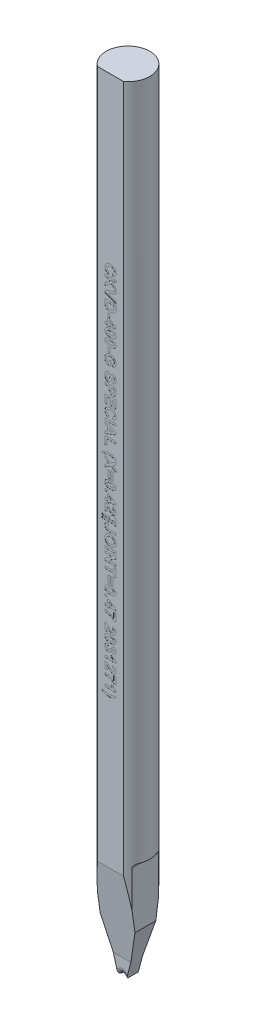
from build123d import *

# Parameters (mm, degrees)
SKETCH_TL_CUTTING_R       = 1.99771
TL_CUTTING_DEPTH          = 72.009
SKETCH_TDF_GRINDING_W     = 4.01542
SKETCH_TDF_GRINDING_H     = 4.01542
TDF_GRINDING_DEPTH        = 73.064400167
SKETCH_ENGRAVING_W        = 0.166666667
SKETCH_ENGRAVING_H        = 0.371794872
SKETCH_ENGRAVING_W_2      = 1
SKETCH_ENGRAVING_H_2      = 0.192307693
SKETCH_ENGRAVING_H_3      = 0.692307692
SKETCH_ENGRAVING_W_3      = 0.192307692
SKETCH_ENGRAVING_H_4      = 0.192307692
ENGRAVING_DEPTH           = 0.005
VW_VR_GRINDING_DEPTH      = 2.00771
VW_VR_GRINDING_DEPTH_BACK = 2.00771
ISA_GRINDING_DEPTH        = 2.00771
ISA_GRINDING_DEPTH_BACK   = 2.00771
PRE_FRX_BRX_DEPTH         = 2.00771
PRE_FRX_BRX_DEPTH_BACK    = 2.00771
SKETCH_PRE_FRX_BRX_W      = 1.46796
SKETCH_PRE_FRX_BRX_H      = 1.4986
FR_EDM_R                  = 0.39878
BR_EDM_R                  = 0.20066
FA_BA_GRINDING_DEPTH      = 2.00771
FA_BA_GRINDING_DEPTH_BACK = 2.00771


with BuildPart() as part:
    # sketch_TL_cutting → TL_cutting (new body)
    with BuildSketch(Plane(origin=(0, 0, 0), x_dir=(1, 0, 0), z_dir=(0, 1, 0))):
        Circle(SKETCH_TL_CUTTING_R)
    extrude(amount=TL_CUTTING_DEPTH)

    # sketch_TDF_grinding → TDF_grinding (cut, through all)
    with BuildSketch(Plane(origin=(0, 0, 0), x_dir=(1, 0, 0), z_dir=(0, 1, 0))):
        with Locations((0, -3.60918)):
            Rectangle(SKETCH_TDF_GRINDING_W, SKETCH_TDF_GRINDING_H)
    extrude(amount=TDF_GRINDING_DEPTH, mode=Mode.SUBTRACT)

    # sketch_engraving → engraving (cut)
    # profile 1 of 45: a face of its own
    with BuildSketch(Plane.XY.offset(1.60147)):
        with BuildLine():
            Line((-0.128205128, 56.265410256), (-0.192307692, 56.073102564))
            add(Edge.make_bspline(
                [(-0.192307692, 56.073102564), (-0.204917923, 56.077009052), (-0.229612721, 56.084659184), (-0.2649877, 56.098737804), (-0.297871332, 56.114732008), (-0.328259475, 56.132559875), (-0.356049464, 56.152295258), (-0.381471598, 56.173789244), (-0.404368127, 56.197253424), (-0.424673345, 56.222670624), (-0.442633936, 56.249763711), (-0.457816548, 56.278856053), (-0.470893242, 56.30951117), (-0.481488041, 56.342040557), (-0.489972889, 56.376228151), (-0.495577171, 56.412234413), (-0.499377062, 56.449890896), (-0.499789062, 56.475603283), (-0.5, 56.488767628)],
                knots=[0, 0, 0, 0, 1.126670901, 2.206376047, 3.246533763, 4.245677351, 5.210506282, 6.152793389, 7.083980095, 8.004497442, 8.926231833, 9.854395169, 10.801995143, 11.768203916, 12.771938831, 13.805609698, 14.87650608, 16, 16, 16, 16], degree=3))
            add(Edge.make_bspline(
                [(-0.5, 56.488767628), (-0.499663994, 56.505016309), (-0.499003061, 56.536977949), (-0.492350465, 56.583719052), (-0.481969511, 56.628260328), (-0.467601869, 56.670669613), (-0.448555271, 56.710648786), (-0.42571373, 56.748573108), (-0.398318662, 56.784009391), (-0.367249987, 56.817150716), (-0.332452821, 56.847279196), (-0.294134751, 56.873272297), (-0.253074131, 56.895810491), (-0.208709772, 56.913736594), (-0.161353037, 56.927821791), (-0.110975156, 56.937668328), (-0.057578507, 56.943834942), (-0.020984357, 56.944537083), (-0.002203526, 56.944897436)],
                knots=[0, 0, 0, 0, 1.025134988, 2.016471176, 2.973446247, 3.909197306, 4.836872559, 5.763618465, 6.698581235, 7.658772073, 8.627106982, 9.597494692, 10.576422683, 11.578339294, 12.6118974, 13.690673505, 14.814808564, 16, 16, 16, 16], degree=3))
            add(Edge.make_bspline(
                [(-0.002203526, 56.944897436), (0.017576475, 56.9445292), (0.056163648, 56.943810839), (0.112313555, 56.937762878), (0.165084042, 56.927716768), (0.214577853, 56.914140058), (0.260470573, 56.895929249), (0.303160692, 56.874073909), (0.342311169, 56.847956152), (0.377833814, 56.818031091), (0.409480853, 56.784897852), (0.437377469, 56.749193428), (0.460593243, 56.710691041), (0.479896446, 56.669867336), (0.494630503, 56.626423397), (0.505304611, 56.580476602), (0.511505561, 56.532006054), (0.512376199, 56.49886808), (0.512820513, 56.481956731)],
                knots=[0, 0, 0, 0, 1.212773307, 2.365899439, 3.458117515, 4.504331001, 5.50806732, 6.480562534, 7.440239902, 8.387651817, 9.323121479, 10.245404239, 11.160468186, 12.07454208, 13.009500751, 13.96802424, 14.963018902, 16, 16, 16, 16], degree=3))
            add(Edge.make_bspline(
                [(0.512820513, 56.481956731), (0.512448361, 56.467187276), (0.511718707, 56.438229796), (0.506761415, 56.395824506), (0.498061698, 56.355636158), (0.486319015, 56.317447521), (0.470821797, 56.281475987), (0.451884357, 56.247657111), (0.429606892, 56.215874651), (0.412205553, 56.196725065), (0.403445513, 56.187084936)],
                knots=[0, 0, 0, 0, 1.098510076, 2.153775193, 3.169777012, 4.153122333, 5.120892526, 6.076995459, 7.031936742, 8, 8, 8, 8], degree=3))
            add(Edge.make_bspline(
                [(0.403445513, 56.187084936), (0.39787141, 56.181497644), (0.386592274, 56.170191818), (0.367549896, 56.155095368), (0.347050772, 56.140782058), (0.324745215, 56.127479068), (0.30046466, 56.115606849), (0.274581981, 56.104594097), (0.246997406, 56.094455069), (0.227800247, 56.088816604), (0.217948718, 56.085923077)],
                knots=[0, 0, 0, 0, 0.885292881, 1.791380647, 2.722937556, 3.69093542, 4.703306561, 5.754477758, 6.847650944, 8, 8, 8, 8], degree=3))
            Line((0.217948718, 56.085923077), (0.179487179, 56.278230769))
            add(Edge.make_bspline(
                [(0.179487179, 56.278230769), (0.1857949, 56.279865288), (0.198219456, 56.283084861), (0.21607256, 56.28959955), (0.233014714, 56.297071208), (0.248625569, 56.3063361), (0.263619506, 56.316162074), (0.277222328, 56.327824773), (0.290109132, 56.340329754), (0.301694454, 56.354218861), (0.312145605, 56.369093589), (0.321339918, 56.384803983), (0.329014435, 56.401388478), (0.335156827, 56.418721754), (0.340319842, 56.436745702), (0.34350638, 56.455632147), (0.345953545, 56.475215752), (0.3460861, 56.488558875), (0.346153846, 56.495378205)],
                knots=[0, 0, 0, 0, 1.051114734, 2.070420253, 3.064047898, 4.034553068, 4.997066449, 5.953344811, 6.921213386, 7.892675544, 8.867420182, 9.852654213, 10.826683617, 11.811917648, 12.818610352, 13.848120519, 14.900229319, 16, 16, 16, 16], degree=3))
            add(Edge.make_bspline(
                [(0.346153846, 56.495378205), (0.345958725, 56.504742256), (0.345576529, 56.52308423), (0.341532101, 56.54981448), (0.335695112, 56.575255692), (0.326982094, 56.59931706), (0.315677399, 56.621931698), (0.302244603, 56.643428905), (0.286035184, 56.663260806), (0.26758257, 56.681899764), (0.246135655, 56.698607721), (0.221779967, 56.713310652), (0.194212535, 56.725504121), (0.163711493, 56.735404409), (0.130202077, 56.743196736), (0.093641969, 56.748761162), (0.054005962, 56.751838434), (0.026581025, 56.752333903), (0.012419872, 56.752589744)],
                knots=[0, 0, 0, 0, 0.93816214, 1.837638998, 2.704791736, 3.551915875, 4.396257554, 5.235807848, 6.087970119, 6.959042444, 7.860386085, 8.80649345, 9.804409709, 10.875695391, 12.017327537, 13.250155505, 14.580089023, 16, 16, 16, 16], degree=3))
            add(Edge.make_bspline(
                [(0.012419872, 56.752589744), (-0.002609028, 56.752336423), (-0.031567402, 56.751848312), (-0.073337178, 56.748771685), (-0.111754322, 56.743171705), (-0.14688701, 56.735482849), (-0.178713725, 56.725532973), (-0.207179389, 56.713359106), (-0.23231734, 56.698886701), (-0.254110839, 56.682138275), (-0.272831387, 56.663537256), (-0.288926796, 56.643587439), (-0.302688307, 56.622406524), (-0.314010391, 56.599867053), (-0.322575422, 56.575883298), (-0.328786932, 56.550652371), (-0.332735688, 56.524081695), (-0.333131326, 56.505875799), (-0.333333333, 56.496580128)],
                knots=[0, 0, 0, 0, 1.475208372, 2.842499301, 4.107722225, 5.282836115, 6.369007568, 7.375918121, 8.315702116, 9.208439171, 10.065831443, 10.90006451, 11.71996243, 12.54067204, 13.369972975, 14.214060185, 15.088124569, 16, 16, 16, 16], degree=3))
            add(Edge.make_bspline(
                [(-0.333333333, 56.496580128), (-0.333161634, 56.489697953), (-0.332824013, 56.476165176), (-0.330681155, 56.456162689), (-0.326591822, 56.43696438), (-0.321184418, 56.418476281), (-0.314399721, 56.400626559), (-0.305696319, 56.38368748), (-0.295693052, 56.367325777), (-0.283969989, 56.35188094), (-0.270808612, 56.337146156), (-0.255597341, 56.323707159), (-0.238701667, 56.311241373), (-0.220008678, 56.299906947), (-0.199678377, 56.28932516), (-0.177394008, 56.280322121), (-0.153515697, 56.271934984), (-0.136789345, 56.267623153), (-0.128205128, 56.265410256)],
                knots=[0, 0, 0, 0, 0.980177776, 1.927374078, 2.859849964, 3.771585772, 4.668674471, 5.574490016, 6.479656464, 7.396337719, 8.332153134, 9.288470092, 10.28125149, 11.318486971, 12.398724812, 13.541284404, 14.738150009, 16, 16, 16, 16], degree=3))
        make_face()
    # profile 2 of 45: a face of its own
    with BuildSketch(Plane.XY.offset(1.60147)):
        Polygon((-0.5, 55.906435897), (0.5, 55.906435897), (0.5, 55.714128205), (0.052283654, 55.714128205), (0.5, 55.292453526), (0.5, 55.028230769), (0.11338141, 55.408038462), (-0.5, 55.015410256), (-0.5, 55.271620192), (-0.035456731, 55.553871795), (-0.198517628, 55.714128205), (-0.5, 55.714128205), align=None)
    # profile 3 of 45: a face of its own
    with BuildSketch(Plane.XY.offset(1.60147)):
        Polygon((-0.5, 54.639208333), (0.5, 55.009), (0.5, 54.805875), (-0.243589744, 54.541051282), (0.5, 54.277229167), (0.5, 54.073102564), (-0.5, 54.441491987), align=None)
    # profile 4 of 45: a face of its own
    with BuildSketch(Plane.XY.offset(1.60147)):
        with BuildLine():
            Line((0.5, 53.983358974), (0.5, 53.616572115))
            add(Edge.make_bspline(
                [(0.5, 53.616572115), (0.500005193, 53.606554571), (0.500015306, 53.587048084), (0.498840892, 53.558739066), (0.497659587, 53.532266494), (0.495294873, 53.507706352), (0.492816233, 53.484973432), (0.489678088, 53.464026942), (0.485656212, 53.444999202), (0.482484481, 53.433000319), (0.480969551, 53.427269231)],
                knots=[0, 0, 0, 0, 1.259756885, 2.453039283, 3.563158368, 4.591894114, 5.55549294, 6.43918076, 7.254497783, 8, 8, 8, 8], degree=3))
            add(Edge.make_bspline(
                [(0.480969551, 53.427269231), (0.478637325, 53.420100254), (0.474014881, 53.405891431), (0.465827813, 53.385038378), (0.455960096, 53.365204479), (0.445111978, 53.345929819), (0.432903728, 53.327657553), (0.419595761, 53.309942873), (0.404753223, 53.293309803), (0.383633179, 53.27177514), (0.35420815, 53.247350255), (0.315375005, 53.22151972), (0.272594656, 53.199782014), (0.234409605, 53.184590641), (0.20183843, 53.174546542), (0.175754603, 53.167978141), (0.148301213, 53.162306468), (0.119383738, 53.158056292), (0.08913491, 53.154394906), (0.057465542, 53.151767238), (0.024383276, 53.15046625), (0.001870575, 53.150174494), (-0.009615385, 53.150025641)],
                knots=[0, 0, 0, 0, 0.745431882, 1.477436776, 2.212739876, 2.934276521, 3.663147754, 4.384200836, 5.123377481, 5.865761747, 7.365547505, 8.894711587, 10.468722596, 12.101948761, 12.951987285, 13.837595333, 14.760899389, 15.722756883, 16.726861385, 17.773652936, 18.864119771, 20, 20, 20, 20], degree=3))
            add(Edge.make_bspline(
                [(-0.009615385, 53.150025641), (-0.0294616, 53.150417046), (-0.067834928, 53.15117384), (-0.123301552, 53.156771211), (-0.17465514, 53.166066648), (-0.206804138, 53.175777075), (-0.222355769, 53.180474359)],
                knots=[0, 0, 0, 0, 1.103491527, 2.133638164, 3.0971734, 4, 4, 4, 4], degree=3))
            add(Edge.make_bspline(
                [(-0.222355769, 53.180474359), (-0.231274521, 53.183648003), (-0.248819098, 53.189891057), (-0.274127236, 53.200815932), (-0.298211673, 53.212620337), (-0.321053432, 53.225402184), (-0.342549771, 53.239226052), (-0.362636394, 53.254143645), (-0.381577746, 53.269923731), (-0.393236239, 53.28135549), (-0.399038462, 53.287044872)],
                knots=[0, 0, 0, 0, 1.090884612, 2.145940218, 3.175104604, 4.181306866, 5.161203701, 6.118658341, 7.063689906, 8, 8, 8, 8], degree=3))
            add(Edge.make_bspline(
                [(-0.399038462, 53.287044872), (-0.407300305, 53.296331145), (-0.424264154, 53.315398431), (-0.445652736, 53.34874995), (-0.464086504, 53.386625276), (-0.473760833, 53.413939168), (-0.478766026, 53.428070513)],
                knots=[0, 0, 0, 0, 0.912008655, 1.872605891, 2.89935344, 4, 4, 4, 4], degree=3))
            add(Edge.make_bspline(
                [(-0.478766026, 53.428070513), (-0.4805228, 53.433790486), (-0.484168894, 53.445661996), (-0.488062998, 53.464485444), (-0.492165475, 53.484579947), (-0.49463687, 53.506177223), (-0.497243066, 53.529053081), (-0.498706299, 53.553389822), (-0.49974511, 53.579103081), (-0.499913777, 53.596739175), (-0.5, 53.605754808)],
                knots=[0, 0, 0, 0, 0.799129865, 1.658552685, 2.566799617, 3.538529252, 4.561352959, 5.643373779, 6.795284424, 8, 8, 8, 8], degree=3))
            Line((-0.5, 53.605754808), (-0.5, 53.983358974))
            Line((-0.5, 53.983358974), (0.5, 53.983358974))
        make_face()
        with BuildLine():
            Line((0.333333333, 53.791051282), (-0.333333333, 53.791051282))
            Line((-0.333333333, 53.791051282), (-0.333333333, 53.632798077))
            add(Edge.make_bspline(
                [(-0.333333333, 53.632798077), (-0.333276671, 53.62565336), (-0.333167574, 53.611897049), (-0.332847006, 53.591991316), (-0.331979167, 53.573698115), (-0.331080228, 53.556921614), (-0.329595022, 53.54170549), (-0.328134266, 53.527983535), (-0.326090699, 53.515832132), (-0.324477534, 53.508327127), (-0.323717949, 53.504793269)],
                knots=[0, 0, 0, 0, 1.333384787, 2.567275092, 3.714769766, 4.750907381, 5.701951617, 6.567520054, 7.325492842, 8, 8, 8, 8], degree=3))
            add(Edge.make_bspline(
                [(-0.323717949, 53.504793269), (-0.321509316, 53.496516575), (-0.317207482, 53.480395757), (-0.307617456, 53.457760499), (-0.296048139, 53.437278507), (-0.282136533, 53.41860677), (-0.26455548, 53.40177967), (-0.242070693, 53.387415683), (-0.215254411, 53.374122192), (-0.189584523, 53.365018806), (-0.16665678, 53.358484413), (-0.147412959, 53.354061165), (-0.126593091, 53.350565591), (-0.104279343, 53.347558942), (-0.080500412, 53.345129499), (-0.055170426, 53.343617784), (-0.028320392, 53.342586029), (-0.009883527, 53.342419161), (-0.000400641, 53.342333333)],
                knots=[0, 0, 0, 0, 1.038686998, 2.023088296, 2.974059649, 3.888265163, 4.839857954, 5.909819677, 7.113156087, 8.466843969, 9.20827164, 10.006482943, 10.861893492, 11.769681931, 12.739021491, 13.762258324, 14.849031541, 16, 16, 16, 16], degree=3))
            add(Edge.make_bspline(
                [(-0.000400641, 53.342333333), (0.009082275, 53.3424185), (0.027452469, 53.342583485), (0.054102292, 53.343613664), (0.079033415, 53.345116863), (0.102276578, 53.347563691), (0.123864169, 53.350523456), (0.143813574, 53.354060891), (0.161996804, 53.358454423), (0.183589283, 53.365007511), (0.207947697, 53.374844996), (0.23429421, 53.388671199), (0.2571147, 53.404936402), (0.276689574, 53.423291558), (0.29287817, 53.444378569), (0.306422028, 53.467749371), (0.316938162, 53.493880279), (0.321416742, 53.512469318), (0.323717949, 53.522020833)],
                knots=[0, 0, 0, 0, 1.118059345, 2.165891593, 3.144157881, 4.062285166, 4.920717571, 5.712910489, 6.449981617, 7.12489426, 8.371943983, 9.541298068, 10.624898781, 11.666293176, 12.69306237, 13.747704633, 14.842713931, 16, 16, 16, 16], degree=3))
            add(Edge.make_bspline(
                [(0.323717949, 53.522020833), (0.324486218, 53.526155143), (0.326177652, 53.535257311), (0.328151987, 53.550361571), (0.329628909, 53.568148179), (0.331099472, 53.588577116), (0.331977905, 53.611627064), (0.332859431, 53.637332571), (0.333166326, 53.665716851), (0.333276065, 53.685549207), (0.333333333, 53.695899038)],
                knots=[0, 0, 0, 0, 0.578739524, 1.274162912, 2.095457587, 3.035141998, 4.093102578, 5.270121571, 6.575369351, 8, 8, 8, 8], degree=3))
            Line((0.333333333, 53.695899038), (0.333333333, 53.791051282))
        make_face(mode=Mode.SUBTRACT)
    # profile 5 of 45: a face of its own
    with BuildSketch(Plane.XY.offset(1.60147)):
        with Locations((-0.147435898, 52.823102564)):
            Rectangle(SKETCH_ENGRAVING_W, SKETCH_ENGRAVING_H)
    # profile 6 of 45: a face of its own
    with BuildSketch(Plane.XY.offset(1.60147)):
        Polygon((-0.5, 52.201307692), (-0.294871795, 52.201307692), (-0.294871795, 52.59874359), (-0.12880609, 52.59874359), (0.487179487, 52.175866987), (0.487179487, 52.009), (-0.128205128, 52.009), (-0.128205128, 51.880794872), (-0.294871795, 51.880794872), (-0.294871795, 52.009), (-0.5, 52.009), align=None)
        Polygon((-0.128205128, 52.201307692), (0.204727564, 52.201307692), (-0.128205128, 52.430073718), align=None, mode=Mode.SUBTRACT)
    # profile 7 of 45: a face of its own
    with BuildSketch(Plane.XY.offset(1.60147)):
        with BuildLine():
            add(Edge.make_bspline(
                [(0.5, 51.476948718), (0.49971384, 51.465044998), (0.499156721, 51.441869821), (0.494192381, 51.408107508), (0.486315205, 51.376354925), (0.474936732, 51.346605943), (0.460535804, 51.318709267), (0.442472771, 51.293057415), (0.421624591, 51.26905643), (0.405435577, 51.255200797), (0.397235577, 51.248182692)],
                knots=[0, 0, 0, 0, 1.098626248, 2.138899374, 3.143835643, 4.113754749, 5.073488057, 6.034745239, 7.004566348, 8, 8, 8, 8], degree=3))
            add(Edge.make_bspline(
                [(0.397235577, 51.248182692), (0.392013767, 51.244167993), (0.381356969, 51.235974695), (0.364136726, 51.22494029), (0.345869985, 51.214331685), (0.326116385, 51.205073442), (0.305221356, 51.196200078), (0.283126793, 51.188009313), (0.259707844, 51.18077695), (0.235071142, 51.174472124), (0.209179241, 51.168578627), (0.181968999, 51.163641398), (0.15350924, 51.159415972), (0.123831018, 51.156120738), (0.092992495, 51.153166339), (0.060842825, 51.151549757), (0.027454838, 51.150225267), (0.004742429, 51.150092949), (-0.006810897, 51.150025641)],
                knots=[0, 0, 0, 0, 0.746775751, 1.524038446, 2.317840886, 3.141016509, 3.996283186, 4.892488336, 5.812382473, 6.774967264, 7.776368117, 8.823659909, 9.910833035, 11.039122168, 12.210293276, 13.424012874, 14.68964937, 16, 16, 16, 16], degree=3))
            add(Edge.make_bspline(
                [(-0.006810897, 51.150025641), (-0.01836425, 51.150091934), (-0.041009977, 51.150221876), (-0.074330982, 51.151554693), (-0.106413621, 51.153167781), (-0.13725379, 51.156113853), (-0.166926114, 51.159440728), (-0.195353975, 51.163546272), (-0.22243919, 51.168864764), (-0.248289812, 51.174671418), (-0.27303117, 51.180936077), (-0.296407841, 51.1884899), (-0.318777777, 51.196350303), (-0.339699687, 51.205429898), (-0.359477735, 51.215020372), (-0.377930928, 51.225471112), (-0.395257891, 51.236628726), (-0.40597091, 51.244901289), (-0.411258013, 51.248983974)],
                knots=[0, 0, 0, 0, 1.308411734, 2.564617834, 3.776541518, 4.94597967, 6.0725993, 7.15816376, 8.197872509, 9.197791611, 10.158952087, 11.086962723, 11.979249638, 12.843171697, 13.668427753, 14.467630577, 15.243743175, 16, 16, 16, 16], degree=3))
            add(Edge.make_bspline(
                [(-0.411258013, 51.248983974), (-0.419387722, 51.255937875), (-0.435436162, 51.269665209), (-0.456111536, 51.293400465), (-0.473801555, 51.3190109), (-0.487914093, 51.346857064), (-0.499368982, 51.376461236), (-0.506993451, 51.408265546), (-0.511967929, 51.441935616), (-0.512532265, 51.465111213), (-0.512820513, 51.476948718)],
                knots=[0, 0, 0, 0, 0.991667276, 1.957599061, 2.911530233, 3.873218945, 4.847995157, 5.850445929, 6.902062539, 8, 8, 8, 8], degree=3))
            add(Edge.make_bspline(
                [(-0.512820513, 51.476948718), (-0.512476011, 51.488921133), (-0.511800941, 51.512381702), (-0.506449472, 51.546635149), (-0.497876451, 51.579194622), (-0.485636462, 51.609943234), (-0.469774335, 51.638836989), (-0.45076002, 51.666101616), (-0.427732542, 51.691143948), (-0.40629523, 51.710749361), (-0.386925042, 51.725092741), (-0.37086259, 51.735209036), (-0.353675124, 51.744985358), (-0.33482528, 51.753423499), (-0.314870578, 51.761748475), (-0.293380967, 51.769121787), (-0.270541238, 51.775626959), (-0.246455682, 51.781734901), (-0.220958398, 51.786828025), (-0.194124629, 51.791512952), (-0.165840258, 51.795204927), (-0.136262825, 51.798478243), (-0.105322509, 51.800782844), (-0.073069943, 51.802654475), (-0.039401887, 51.803592969), (-0.01649349, 51.803777608), (-0.004807692, 51.803871795)],
                knots=[0, 0, 0, 0, 1.257818097, 2.464759732, 3.634271214, 4.790227596, 5.933394726, 7.09190477, 8.274482889, 9.50191983, 10.139172818, 10.805000628, 11.49619854, 12.215266328, 12.973768034, 13.768328009, 14.601232062, 15.469317089, 16.379095881, 17.333267023, 18.331755967, 19.376479622, 20.460535752, 21.592206075, 22.771760786, 24, 24, 24, 24], degree=3))
            add(Edge.make_bspline(
                [(-0.004807692, 51.803871795), (0.006678925, 51.803806), (0.02919122, 51.803677052), (0.062378132, 51.802334948), (0.094328674, 51.800741634), (0.12509981, 51.79776902), (0.154640959, 51.794469515), (0.183004063, 51.790356894), (0.209982531, 51.784938814), (0.235876189, 51.779589743), (0.260431507, 51.772849782), (0.2837906, 51.765424475), (0.306110518, 51.757590136), (0.326924245, 51.748417854), (0.346659803, 51.738882898), (0.365109758, 51.728424838), (0.382437536, 51.717269066), (0.39315045, 51.708996265), (0.3984375, 51.704913462)],
                knots=[0, 0, 0, 0, 1.304443357, 2.556541329, 3.771813033, 4.936929721, 6.066661712, 7.147723817, 8.190304831, 9.191350322, 10.149780912, 11.080355239, 11.975107155, 12.834450748, 13.66198663, 14.463397305, 15.241653965, 16, 16, 16, 16], degree=3))
            add(Edge.make_bspline(
                [(0.3984375, 51.704913462), (0.406566428, 51.697959179), (0.422613323, 51.684231089), (0.443299998, 51.660501361), (0.460913987, 51.634919209), (0.475197493, 51.607154301), (0.486497465, 51.577482107), (0.494183265, 51.545636121), (0.499144648, 51.511960686), (0.499710816, 51.488785839), (0.5, 51.476948718)],
                knots=[0, 0, 0, 0, 0.991631672, 1.957528776, 2.911425699, 3.867574088, 4.848108326, 5.850523106, 6.902101959, 8, 8, 8, 8], degree=3))
        make_face()
        with BuildLine():
            add(Edge.make_bspline(
                [(0.333333333, 51.476948718), (0.333068079, 51.483116684), (0.332548986, 51.495187158), (0.328316127, 51.512742094), (0.321759633, 51.529323165), (0.312130705, 51.544881206), (0.299093083, 51.55928978), (0.281476094, 51.571497658), (0.259881539, 51.582051162), (0.243736, 51.587330771), (0.235176282, 51.590129808)],
                knots=[0, 0, 0, 0, 0.909107913, 1.77908945, 2.650019014, 3.530482969, 4.465025013, 5.495890128, 6.672421267, 8, 8, 8, 8], degree=3))
            add(Edge.make_bspline(
                [(0.235176282, 51.590129808), (0.228718042, 51.591877997), (0.214837576, 51.595635317), (0.192206647, 51.59989972), (0.166522939, 51.603416485), (0.137792419, 51.606386038), (0.105999886, 51.608802628), (0.071125109, 51.610290848), (0.033192525, 51.611319478), (0.006878451, 51.611480391), (-0.006810897, 51.611564103)],
                knots=[0, 0, 0, 0, 0.658986521, 1.416336438, 2.266694271, 3.212608458, 4.261595115, 5.407496572, 6.651304179, 8, 8, 8, 8], degree=3))
            add(Edge.make_bspline(
                [(-0.006810897, 51.611564103), (-0.020433943, 51.611573117), (-0.046549094, 51.611590397), (-0.084006477, 51.610416163), (-0.118154033, 51.60924872), (-0.148991056, 51.606879061), (-0.176626244, 51.604540892), (-0.200847568, 51.601003343), (-0.221857789, 51.597450608), (-0.244486895, 51.591417153), (-0.268257705, 51.583101394), (-0.292448985, 51.571872977), (-0.311537375, 51.559207058), (-0.325415776, 51.544675587), (-0.334597404, 51.528930329), (-0.341538269, 51.512626395), (-0.345246665, 51.495074555), (-0.345848983, 51.483040013), (-0.346153846, 51.476948718)],
                knots=[0, 0, 0, 0, 1.613038927, 3.092168624, 4.43749063, 5.658264602, 6.75425577, 7.720394221, 8.556328411, 9.275513998, 10.490872946, 11.534172084, 12.42681833, 13.187531851, 13.88996177, 14.574222125, 15.278341114, 16, 16, 16, 16], degree=3))
            add(Edge.make_bspline(
                [(-0.346153846, 51.476948718), (-0.345874419, 51.47085088), (-0.345321688, 51.458788799), (-0.341225408, 51.441256833), (-0.334465655, 51.424699336), (-0.325029126, 51.409036493), (-0.311901617, 51.39461441), (-0.294300445, 51.382397614), (-0.272700888, 51.37184693), (-0.25655611, 51.366566893), (-0.247996795, 51.363767628)],
                knots=[0, 0, 0, 0, 0.899391665, 1.779078861, 2.640979247, 3.529945348, 4.464599804, 5.495588918, 6.672261578, 8, 8, 8, 8], degree=3))
            add(Edge.make_bspline(
                [(-0.247996795, 51.363767628), (-0.241538043, 51.362021968), (-0.227719754, 51.358287186), (-0.205229709, 51.353992396), (-0.179679092, 51.35046611), (-0.151079269, 51.347524791), (-0.11935541, 51.345084431), (-0.084546407, 51.343608845), (-0.046680798, 51.342579247), (-0.020433482, 51.342417356), (-0.006810897, 51.342333333)],
                knots=[0, 0, 0, 0, 0.66114423, 1.414496391, 2.261103113, 3.210114492, 4.255954433, 5.405607896, 6.653488082, 8, 8, 8, 8], degree=3))
            add(Edge.make_bspline(
                [(-0.006810897, 51.342333333), (0.006810741, 51.342447109), (0.032921137, 51.342665199), (0.070464093, 51.343292091), (0.104645163, 51.345047006), (0.13553417, 51.346803226), (0.163028833, 51.349768631), (0.187277888, 51.352711537), (0.208178651, 51.356783667), (0.23096624, 51.362375697), (0.254848985, 51.37071368), (0.278913284, 51.38228584), (0.298191428, 51.39472291), (0.312146257, 51.409229879), (0.321683592, 51.424948044), (0.328364426, 51.441400374), (0.332523972, 51.458849531), (0.333060584, 51.47084941), (0.333333333, 51.476948718)],
                knots=[0, 0, 0, 0, 1.611458614, 3.088895909, 4.441089836, 5.660086535, 6.747875232, 7.711965119, 8.548505902, 9.26500436, 10.486583113, 11.532259092, 12.419544583, 13.184925779, 13.890764661, 14.581638641, 15.279074115, 16, 16, 16, 16], degree=3))
        make_face(mode=Mode.SUBTRACT)
    # profile 8 of 45: a face of its own
    with BuildSketch(Plane.XY.offset(1.60147)):
        with BuildLine():
            add(Edge.make_bspline(
                [(0.5, 50.707717949), (0.49971384, 50.695814229), (0.499156721, 50.672639051), (0.494192381, 50.638876739), (0.486315205, 50.607124156), (0.474936732, 50.577375173), (0.460535804, 50.549478497), (0.442472771, 50.523826646), (0.421624591, 50.499825661), (0.405435577, 50.485970028), (0.397235577, 50.478951923)],
                knots=[0, 0, 0, 0, 1.098626248, 2.138899374, 3.143835643, 4.113754749, 5.073488057, 6.034745239, 7.004566348, 8, 8, 8, 8], degree=3))
            add(Edge.make_bspline(
                [(0.397235577, 50.478951923), (0.392013767, 50.474937224), (0.381356969, 50.466743926), (0.364136726, 50.45570952), (0.345869985, 50.445100915), (0.326116385, 50.435842673), (0.305221356, 50.426969309), (0.283126793, 50.418778544), (0.259707844, 50.41154618), (0.235071142, 50.405241354), (0.209179241, 50.399347858), (0.181968999, 50.394410628), (0.15350924, 50.390185203), (0.123831018, 50.386889969), (0.092992495, 50.38393557), (0.060842825, 50.382318988), (0.027454838, 50.380994498), (0.004742429, 50.380862179), (-0.006810897, 50.380794872)],
                knots=[0, 0, 0, 0, 0.746775751, 1.524038446, 2.317840886, 3.141016509, 3.996283186, 4.892488336, 5.812382473, 6.774967264, 7.776368117, 8.823659909, 9.910833035, 11.039122168, 12.210293276, 13.424012874, 14.68964937, 16, 16, 16, 16], degree=3))
            add(Edge.make_bspline(
                [(-0.006810897, 50.380794872), (-0.01836425, 50.380861165), (-0.041009977, 50.380991107), (-0.074330982, 50.382323924), (-0.106413621, 50.383937012), (-0.13725379, 50.386883084), (-0.166926114, 50.390209959), (-0.195353975, 50.394315503), (-0.22243919, 50.399633995), (-0.248289812, 50.405440649), (-0.27303117, 50.411705308), (-0.296407841, 50.419259131), (-0.318777777, 50.427119533), (-0.339699687, 50.436199129), (-0.359477735, 50.445789602), (-0.377930928, 50.456240342), (-0.395257891, 50.467397957), (-0.40597091, 50.47567052), (-0.411258013, 50.479753205)],
                knots=[0, 0, 0, 0, 1.308411734, 2.564617834, 3.776541518, 4.94597967, 6.0725993, 7.15816376, 8.197872509, 9.197791611, 10.158952087, 11.086962723, 11.979249638, 12.843171697, 13.668427753, 14.467630577, 15.243743175, 16, 16, 16, 16], degree=3))
            add(Edge.make_bspline(
                [(-0.411258013, 50.479753205), (-0.419387722, 50.486707105), (-0.435436162, 50.50043444), (-0.456111536, 50.524169695), (-0.473801555, 50.549780131), (-0.487914093, 50.577626295), (-0.499368982, 50.607230467), (-0.506993451, 50.639034777), (-0.511967929, 50.672704847), (-0.512532265, 50.695880444), (-0.512820513, 50.707717949)],
                knots=[0, 0, 0, 0, 0.991667276, 1.957599061, 2.911530233, 3.873218945, 4.847995157, 5.850445929, 6.902062539, 8, 8, 8, 8], degree=3))
            add(Edge.make_bspline(
                [(-0.512820513, 50.707717949), (-0.512476011, 50.719690364), (-0.511800941, 50.743150933), (-0.506449472, 50.777404379), (-0.497876451, 50.809963853), (-0.485636462, 50.840712465), (-0.469774335, 50.86960622), (-0.45076002, 50.896870847), (-0.427732542, 50.921913179), (-0.40629523, 50.941518592), (-0.386925042, 50.955861971), (-0.37086259, 50.965978267), (-0.353675124, 50.975754589), (-0.33482528, 50.98419273), (-0.314870578, 50.992517706), (-0.293380967, 50.999891018), (-0.270541238, 51.00639619), (-0.246455682, 51.012504132), (-0.220958398, 51.017597256), (-0.194124629, 51.022282183), (-0.165840258, 51.025974157), (-0.136262825, 51.029247473), (-0.105322509, 51.031552075), (-0.073069943, 51.033423706), (-0.039401887, 51.0343622), (-0.01649349, 51.034546839), (-0.004807692, 51.034641026)],
                knots=[0, 0, 0, 0, 1.257818097, 2.464759732, 3.634271214, 4.790227596, 5.933394726, 7.09190477, 8.274482889, 9.50191983, 10.139172818, 10.805000628, 11.49619854, 12.215266328, 12.973768034, 13.768328009, 14.601232062, 15.469317089, 16.379095881, 17.333267023, 18.331755967, 19.376479622, 20.460535752, 21.592206075, 22.771760786, 24, 24, 24, 24], degree=3))
            add(Edge.make_bspline(
                [(-0.004807692, 51.034641026), (0.006678925, 51.034575231), (0.02919122, 51.034446282), (0.062378132, 51.033104179), (0.094328674, 51.031510865), (0.12509981, 51.028538251), (0.154640959, 51.025238746), (0.183004063, 51.021126125), (0.209982531, 51.015708045), (0.235876189, 51.010358974), (0.260431507, 51.003619013), (0.2837906, 50.996193706), (0.306110518, 50.988359367), (0.326924245, 50.979187084), (0.346659803, 50.969652128), (0.365109758, 50.959194069), (0.382437536, 50.948038297), (0.39315045, 50.939765495), (0.3984375, 50.935682692)],
                knots=[0, 0, 0, 0, 1.304443357, 2.556541329, 3.771813033, 4.936929721, 6.066661712, 7.147723817, 8.190304831, 9.191350322, 10.149780912, 11.080355239, 11.975107155, 12.834450748, 13.66198663, 14.463397305, 15.241653965, 16, 16, 16, 16], degree=3))
            add(Edge.make_bspline(
                [(0.3984375, 50.935682692), (0.406566428, 50.92872841), (0.422613323, 50.91500032), (0.443299998, 50.891270592), (0.460913987, 50.865688439), (0.475197493, 50.837923532), (0.486497465, 50.808251338), (0.494183265, 50.776405352), (0.499144648, 50.742729916), (0.499710816, 50.71955507), (0.5, 50.707717949)],
                knots=[0, 0, 0, 0, 0.991631672, 1.957528776, 2.911425699, 3.867574088, 4.848108326, 5.850523106, 6.902101959, 8, 8, 8, 8], degree=3))
        make_face()
        with BuildLine():
            add(Edge.make_bspline(
                [(0.333333333, 50.707717949), (0.333068079, 50.713885915), (0.332548986, 50.725956389), (0.328316127, 50.743511325), (0.321759633, 50.760092396), (0.312130705, 50.775650436), (0.299093083, 50.790059011), (0.281476094, 50.802266888), (0.259881539, 50.812820392), (0.243736, 50.818100001), (0.235176282, 50.820899038)],
                knots=[0, 0, 0, 0, 0.909107913, 1.77908945, 2.650019014, 3.530482969, 4.465025013, 5.495890128, 6.672421267, 8, 8, 8, 8], degree=3))
            add(Edge.make_bspline(
                [(0.235176282, 50.820899038), (0.228718042, 50.822647227), (0.214837576, 50.826404548), (0.192206647, 50.830668951), (0.166522939, 50.834185716), (0.137792419, 50.837155269), (0.105999886, 50.839571859), (0.071125109, 50.841060078), (0.033192525, 50.842088709), (0.006878451, 50.842249622), (-0.006810897, 50.842333333)],
                knots=[0, 0, 0, 0, 0.658986521, 1.416336438, 2.266694271, 3.212608458, 4.261595115, 5.407496572, 6.651304179, 8, 8, 8, 8], degree=3))
            add(Edge.make_bspline(
                [(-0.006810897, 50.842333333), (-0.020433943, 50.842342347), (-0.046549094, 50.842359627), (-0.084006477, 50.841185394), (-0.118154033, 50.840017951), (-0.148991056, 50.837648292), (-0.176626244, 50.835310123), (-0.200847568, 50.831772574), (-0.221857789, 50.828219839), (-0.244486895, 50.822186384), (-0.268257705, 50.813870625), (-0.292448985, 50.802642207), (-0.311537375, 50.789976289), (-0.325415776, 50.775444818), (-0.334597404, 50.75969956), (-0.341538269, 50.743395625), (-0.345246665, 50.725843786), (-0.345848983, 50.713809244), (-0.346153846, 50.707717949)],
                knots=[0, 0, 0, 0, 1.613038927, 3.092168624, 4.43749063, 5.658264602, 6.75425577, 7.720394221, 8.556328411, 9.275513998, 10.490872946, 11.534172084, 12.42681833, 13.187531851, 13.88996177, 14.574222125, 15.278341114, 16, 16, 16, 16], degree=3))
            add(Edge.make_bspline(
                [(-0.346153846, 50.707717949), (-0.345874419, 50.701620111), (-0.345321688, 50.68955803), (-0.341225408, 50.672026063), (-0.334465655, 50.655468567), (-0.325029126, 50.639805723), (-0.311901617, 50.625383641), (-0.294300445, 50.613166845), (-0.272700888, 50.602616161), (-0.25655611, 50.597336123), (-0.247996795, 50.594536859)],
                knots=[0, 0, 0, 0, 0.899391665, 1.779078861, 2.640979247, 3.529945348, 4.464599804, 5.495588918, 6.672261578, 8, 8, 8, 8], degree=3))
            add(Edge.make_bspline(
                [(-0.247996795, 50.594536859), (-0.241538043, 50.592791199), (-0.227719754, 50.589056417), (-0.205229709, 50.584761627), (-0.179679092, 50.58123534), (-0.151079269, 50.578294022), (-0.11935541, 50.575853662), (-0.084546407, 50.574378076), (-0.046680798, 50.573348478), (-0.020433482, 50.573186587), (-0.006810897, 50.573102564)],
                knots=[0, 0, 0, 0, 0.66114423, 1.414496391, 2.261103113, 3.210114492, 4.255954433, 5.405607896, 6.653488082, 8, 8, 8, 8], degree=3))
            add(Edge.make_bspline(
                [(-0.006810897, 50.573102564), (0.006810741, 50.57321634), (0.032921137, 50.57343443), (0.070464093, 50.574061322), (0.104645163, 50.575816237), (0.13553417, 50.577572457), (0.163028833, 50.580537861), (0.187277888, 50.583480768), (0.208178651, 50.587552897), (0.23096624, 50.593144928), (0.254848985, 50.60148291), (0.278913284, 50.613055071), (0.298191428, 50.625492141), (0.312146257, 50.63999911), (0.321683592, 50.655717274), (0.328364426, 50.672169605), (0.332523972, 50.689618762), (0.333060584, 50.701618641), (0.333333333, 50.707717949)],
                knots=[0, 0, 0, 0, 1.611458614, 3.088895909, 4.441089836, 5.660086535, 6.747875232, 7.711965119, 8.548505902, 9.26500436, 10.486583113, 11.532259092, 12.419544583, 13.184925779, 13.890764661, 14.581638641, 15.279074115, 16, 16, 16, 16], degree=3))
        make_face(mode=Mode.SUBTRACT)
    # profile 9 of 45: a face of its own
    with BuildSketch(Plane.XY.offset(1.60147)):
        with Locations((-0.147435898, 50.053871795)):
            Rectangle(SKETCH_ENGRAVING_W, SKETCH_ENGRAVING_H)
    # profile 10 of 45: a face of its own
    with BuildSketch(Plane.XY.offset(1.60147)):
        with BuildLine():
            Line((-0.128205128, 49.303871795), (0.038461538, 49.303871795))
            Line((0.038461538, 49.303871795), (0.038461538, 48.867974359))
            Line((0.038461538, 48.867974359), (-0.36338141, 48.867974359))
            add(Edge.make_bspline(
                [(-0.36338141, 48.867974359), (-0.368321434, 48.873460375), (-0.378419843, 48.8846749), (-0.392661125, 48.902972664), (-0.406257259, 48.923116779), (-0.4194836, 48.944985469), (-0.432233696, 48.968623992), (-0.444685123, 48.993938064), (-0.45671611, 49.020974391), (-0.471787381, 49.059207711), (-0.488186169, 49.10842183), (-0.502445448, 49.168587076), (-0.511191227, 49.229228267), (-0.512277771, 49.269789075), (-0.512820513, 49.290049679)],
                knots=[0, 0, 0, 0, 0.581799769, 1.189316438, 1.825828404, 2.496525428, 3.203088405, 3.942228803, 4.719818701, 5.534979611, 7.181138583, 8.803804008, 10.403462225, 12, 12, 12, 12], degree=3))
            add(Edge.make_bspline(
                [(-0.512820513, 49.290049679), (-0.512629241, 49.302742166), (-0.512252188, 49.327762831), (-0.509233571, 49.364701118), (-0.504017902, 49.400418224), (-0.496780719, 49.434850736), (-0.487836372, 49.468101646), (-0.476607913, 49.500054166), (-0.463065488, 49.530674068), (-0.447986133, 49.560190581), (-0.430657849, 49.588043177), (-0.411724289, 49.614287023), (-0.390891397, 49.638667404), (-0.36853351, 49.661396217), (-0.344060025, 49.682044803), (-0.318106216, 49.701126641), (-0.290219674, 49.718185038), (-0.260879177, 49.733511559), (-0.230317098, 49.747140942), (-0.198781008, 49.758643246), (-0.166726875, 49.768726922), (-0.134042675, 49.777014707), (-0.10062201, 49.783101654), (-0.066619552, 49.787833529), (-0.031822841, 49.790375004), (-0.008417054, 49.790824325), (0.003405449, 49.791051282)],
                knots=[0, 0, 0, 0, 1.124897971, 2.217508473, 3.282174662, 4.322209414, 5.334422951, 6.332119154, 7.320662553, 8.300074908, 9.267468154, 10.225199689, 11.165658754, 12.107290334, 13.047749399, 14.00069605, 14.959944213, 15.942088746, 16.933021067, 17.923599838, 18.915715637, 19.910475908, 20.909926025, 21.925232038, 22.952013513, 24, 24, 24, 24], degree=3))
            add(Edge.make_bspline(
                [(0.003405449, 49.791051282), (0.016165747, 49.790867383), (0.041321811, 49.790504838), (0.078501182, 49.787375194), (0.114594914, 49.782527239), (0.149519517, 49.775132247), (0.183523729, 49.766278796), (0.216299841, 49.754934109), (0.248180515, 49.741980661), (0.278688999, 49.726696543), (0.308028284, 49.709813971), (0.335510174, 49.6906304), (0.361403632, 49.6698108), (0.385591047, 49.647167968), (0.407627145, 49.622329007), (0.428063784, 49.595803308), (0.447146094, 49.56760846), (0.457908016, 49.547431736), (0.463341346, 49.537245192)],
                knots=[0, 0, 0, 0, 1.105132952, 2.178694671, 3.229818344, 4.257558797, 5.269123684, 6.27148554, 7.259679084, 8.247804916, 9.224967877, 10.189258471, 11.147685264, 12.101072275, 13.055511435, 14.02039165, 15.000562851, 16, 16, 16, 16], degree=3))
            add(Edge.make_bspline(
                [(0.463341346, 49.537245192), (0.467347168, 49.529157841), (0.475455657, 49.512787618), (0.485329628, 49.486714525), (0.494054347, 49.459346948), (0.500719187, 49.430365473), (0.506115234, 49.400078993), (0.510216979, 49.368337917), (0.512307439, 49.335083708), (0.512647258, 49.312421284), (0.512820513, 49.300866987)],
                knots=[0, 0, 0, 0, 0.887950456, 1.797368171, 2.741221183, 3.713797788, 4.722103116, 5.768966405, 6.862521341, 8, 8, 8, 8], degree=3))
            add(Edge.make_bspline(
                [(0.512820513, 49.300866987), (0.512598613, 49.285969487), (0.512167059, 49.256996604), (0.508571106, 49.21475631), (0.502373597, 49.175002674), (0.493837942, 49.137680334), (0.482863355, 49.102869697), (0.469371425, 49.070630687), (0.453633675, 49.040765429), (0.435019378, 49.013706485), (0.414494937, 48.988903918), (0.392035387, 48.966422449), (0.367607461, 48.946253031), (0.341334074, 48.928382318), (0.313106625, 48.912950967), (0.283182558, 48.899682952), (0.251334696, 48.888761769), (0.22921692, 48.883483803), (0.217948718, 48.880794872)],
                knots=[0, 0, 0, 0, 1.271135529, 2.472123572, 3.614091059, 4.701890498, 5.736279567, 6.724681829, 7.680621489, 8.611506429, 9.52200816, 10.424540711, 11.318996785, 12.221421405, 13.131851814, 14.060431888, 15.011860567, 16, 16, 16, 16], degree=3))
            Line((0.217948718, 48.880794872), (0.179487179, 49.073102564))
            add(Edge.make_bspline(
                [(0.179487179, 49.073102564), (0.185798707, 49.075005146), (0.198251232, 49.078758905), (0.216108293, 49.086065481), (0.232994438, 49.094383603), (0.248643132, 49.104210597), (0.263649233, 49.114648251), (0.277161531, 49.126918435), (0.290187329, 49.139825453), (0.301701762, 49.154316609), (0.312086782, 49.169755164), (0.321450083, 49.185976632), (0.329043783, 49.203344974), (0.335153652, 49.221617597), (0.340342569, 49.240705002), (0.343533767, 49.26085634), (0.345940549, 49.2818453), (0.346081986, 49.296185325), (0.346153846, 49.303471154)],
                knots=[0, 0, 0, 0, 1.027780279, 2.027791312, 3.006028774, 3.96000864, 4.908113241, 5.852721087, 6.802883308, 7.765918715, 8.733730415, 9.704005314, 10.683351261, 11.68471758, 12.707948499, 13.764514378, 14.864202456, 16, 16, 16, 16], degree=3))
            add(Edge.make_bspline(
                [(0.346153846, 49.303471154), (0.345859633, 49.314498511), (0.34528545, 49.336019337), (0.341538784, 49.367436876), (0.334873123, 49.397076442), (0.325679114, 49.42501554), (0.313877959, 49.451305391), (0.299029501, 49.475590737), (0.282012344, 49.49847627), (0.262039987, 49.519310747), (0.239645267, 49.53820525), (0.214561065, 49.554561822), (0.186868462, 49.568178599), (0.156706511, 49.579331515), (0.124073954, 49.588211616), (0.088855272, 49.594235764), (0.051104495, 49.598171833), (0.02505068, 49.598549093), (0.01161859, 49.59874359)],
                knots=[0, 0, 0, 0, 1.043810997, 2.037086103, 2.989314757, 3.91471467, 4.817033861, 5.710208705, 6.603920097, 7.511448416, 8.435617211, 9.371747005, 10.338444094, 11.350425613, 12.411431869, 13.5347293, 14.729025275, 16, 16, 16, 16], degree=3))
            add(Edge.make_bspline(
                [(0.01161859, 49.59874359), (-0.002813331, 49.598540916), (-0.03086261, 49.598147007), (-0.071503034, 49.594312106), (-0.109371212, 49.588013885), (-0.14440027, 49.578946527), (-0.176807311, 49.567639264), (-0.206438048, 49.553659735), (-0.233109204, 49.536851899), (-0.256980675, 49.517789064), (-0.278169336, 49.496752253), (-0.296147735, 49.473689293), (-0.31184176, 49.449431086), (-0.32420794, 49.423291286), (-0.33413508, 49.395742798), (-0.341078682, 49.366516769), (-0.345395871, 49.335718498), (-0.345897627, 49.314636945), (-0.346153846, 49.303871795)],
                knots=[0, 0, 0, 0, 1.31821493, 2.562027667, 3.72541598, 4.821825939, 5.863743127, 6.857000185, 7.808227391, 8.737146514, 9.643023621, 10.529087527, 11.404035307, 12.277173472, 13.164790074, 14.074766194, 15.016892606, 16, 16, 16, 16], degree=3))
            add(Edge.make_bspline(
                [(-0.346153846, 49.303871795), (-0.345850315, 49.292968504), (-0.34524035, 49.271057617), (-0.340086045, 49.238236537), (-0.332449955, 49.205236283), (-0.321065283, 49.172843933), (-0.307937779, 49.141457225), (-0.292687307, 49.112291024), (-0.276962331, 49.084898447), (-0.264654274, 49.068385969), (-0.258613782, 49.060282051)],
                knots=[0, 0, 0, 0, 0.993779204, 1.997065276, 3.023588959, 4.078879359, 5.123947549, 6.123456565, 7.079038607, 8, 8, 8, 8], degree=3))
            Line((-0.258613782, 49.060282051), (-0.128205128, 49.060282051))
            Line((-0.128205128, 49.060282051), (-0.128205128, 49.303871795))
        make_face()
    # profile 11 of 45: a face of its own
    with BuildSketch(Plane.XY.offset(1.60147)):
        with BuildLine():
            Line((-0.166666667, 48.342333333), (-0.153846154, 48.150025641))
            add(Edge.make_bspline(
                [(-0.153846154, 48.150025641), (-0.161891279, 48.148492992), (-0.177518424, 48.145515918), (-0.199795017, 48.138912009), (-0.220541784, 48.131605841), (-0.239662803, 48.122992964), (-0.25710555, 48.113127896), (-0.273156714, 48.102337618), (-0.28732832, 48.090094862), (-0.299925293, 48.076763176), (-0.310783278, 48.062189999), (-0.320246275, 48.046489399), (-0.328256178, 48.029568131), (-0.334922245, 48.011490819), (-0.339885492, 47.992077406), (-0.343420115, 47.971509762), (-0.345682646, 47.949754761), (-0.345994208, 47.934887096), (-0.346153846, 47.927269231)],
                knots=[0, 0, 0, 0, 1.20477517, 2.340199137, 3.415898527, 4.440826703, 5.422227366, 6.362763262, 7.28278988, 8.172822029, 9.057410505, 9.952475558, 10.866920142, 11.809098, 12.784128911, 13.811833846, 14.878831738, 16, 16, 16, 16], degree=3))
            add(Edge.make_bspline(
                [(-0.346153846, 47.927269231), (-0.346066367, 47.919250933), (-0.345896216, 47.903654929), (-0.343785338, 47.881054596), (-0.340761278, 47.859922259), (-0.335974263, 47.840444522), (-0.330620744, 47.822257658), (-0.323296559, 47.805813353), (-0.314849171, 47.790845499), (-0.305263574, 47.777392657), (-0.294632459, 47.765652348), (-0.28353392, 47.755381341), (-0.272207737, 47.746435972), (-0.260151301, 47.739395334), (-0.247852227, 47.733697439), (-0.234943611, 47.72993153), (-0.221721863, 47.727387435), (-0.212685699, 47.727095702), (-0.208133013, 47.726948718)],
                knots=[0, 0, 0, 0, 1.417779877, 2.757654889, 4.012140507, 5.189587551, 6.302846416, 7.360586765, 8.365575446, 9.33904572, 10.275781718, 11.161696098, 12.012180333, 12.822428111, 13.625933072, 14.403138519, 15.195454004, 16, 16, 16, 16], degree=3))
            add(Edge.make_bspline(
                [(-0.208133013, 47.726948718), (-0.202439146, 47.727242996), (-0.191320796, 47.727817629), (-0.175220679, 47.731587928), (-0.160658688, 47.738392431), (-0.147071392, 47.747628971), (-0.134926522, 47.760593369), (-0.123459543, 47.776997524), (-0.11316916, 47.797457237), (-0.107424402, 47.812625842), (-0.104366987, 47.820698718)],
                knots=[0, 0, 0, 0, 0.906150226, 1.7694295, 2.610923838, 3.450874087, 4.367551936, 5.419872502, 6.626831617, 8, 8, 8, 8], degree=3))
            add(Edge.make_bspline(
                [(-0.104366987, 47.820698718), (-0.103205903, 47.824162905), (-0.100607587, 47.831915194), (-0.096897182, 47.845141154), (-0.092218385, 47.861126556), (-0.087052561, 47.880019979), (-0.081545375, 47.901782885), (-0.074955523, 47.926208532), (-0.068334023, 47.953667832), (-0.063456004, 47.972880895), (-0.060897436, 47.982958333)],
                knots=[0, 0, 0, 0, 0.521824192, 1.167757792, 1.961731518, 2.901193269, 3.965386864, 5.168422915, 6.514810244, 8, 8, 8, 8], degree=3))
            add(Edge.make_bspline(
                [(-0.060897436, 47.982958333), (-0.0576208, 47.996081849), (-0.051299067, 48.021401528), (-0.040053153, 48.057513187), (-0.028879714, 48.090772685), (-0.016755933, 48.120859788), (-0.004503472, 48.148106368), (0.008737874, 48.172071704), (0.022280434, 48.1932559), (0.032402475, 48.205600422), (0.037259615, 48.211524038)],
                knots=[0, 0, 0, 0, 1.293880989, 2.496331788, 3.617634808, 4.64976062, 5.598842568, 6.473791081, 7.267636666, 8, 8, 8, 8], degree=3))
            add(Edge.make_bspline(
                [(0.037259615, 48.211524038), (0.044137694, 48.218870092), (0.057622804, 48.233272711), (0.079781426, 48.252231522), (0.103188466, 48.268162086), (0.127671148, 48.281274684), (0.153370416, 48.291371137), (0.180114252, 48.298527373), (0.207972454, 48.303159148), (0.22694455, 48.303631789), (0.236578526, 48.303871795)],
                knots=[0, 0, 0, 0, 1.064429417, 2.086912298, 3.078678339, 4.055528992, 5.020032834, 5.993708893, 6.981211098, 8, 8, 8, 8], degree=3))
            add(Edge.make_bspline(
                [(0.236578526, 48.303871795), (0.249044725, 48.303404331), (0.273773943, 48.302477024), (0.310123415, 48.29397467), (0.34519423, 48.28072628), (0.373053378, 48.265373891), (0.394102454, 48.250595366), (0.409316468, 48.238368713), (0.423234984, 48.224678899), (0.436363342, 48.210017469), (0.448421192, 48.194138333), (0.459337354, 48.177021959), (0.469762031, 48.158990204), (0.481724432, 48.132677828), (0.494501972, 48.097146959), (0.505216674, 48.050911911), (0.511620444, 48.000566137), (0.512410831, 47.965616875), (0.512820513, 47.947501603)],
                knots=[0, 0, 0, 0, 1.180224575, 2.341213254, 3.519178081, 4.726056898, 5.344182394, 5.956118988, 6.573855441, 7.192564044, 7.82049682, 8.461345463, 9.116141012, 9.79299132, 11.198532007, 12.687823846, 14.283197644, 16, 16, 16, 16], degree=3))
            add(Edge.make_bspline(
                [(0.512820513, 47.947501603), (0.512622915, 47.932668568), (0.512238592, 47.903818634), (0.508327094, 47.862000661), (0.502300976, 47.822992321), (0.493471523, 47.786857475), (0.482080613, 47.753528087), (0.468307987, 47.722939204), (0.4520288, 47.695171205), (0.433078398, 47.670519232), (0.412189308, 47.648555993), (0.389371716, 47.629396757), (0.364914548, 47.612968024), (0.338835479, 47.599163833), (0.311000478, 47.588323434), (0.281444264, 47.58036159), (0.250236407, 47.575095557), (0.228852471, 47.57377561), (0.217948718, 47.573102564)],
                knots=[0, 0, 0, 0, 1.325136797, 2.577362738, 3.74962816, 4.849499017, 5.896771726, 6.892816139, 7.842473141, 8.766187929, 9.665133525, 10.546015357, 11.42313021, 12.293255665, 13.177485873, 14.086514152, 15.024305989, 16, 16, 16, 16], degree=3))
            Line((0.217948718, 47.573102564), (0.205128205, 47.765410256))
            add(Edge.make_bspline(
                [(0.205128205, 47.765410256), (0.211158714, 47.766519181), (0.22291155, 47.768680361), (0.239739753, 47.773387468), (0.255319488, 47.778668235), (0.269550394, 47.784934545), (0.282452554, 47.792152876), (0.29405422, 47.800357056), (0.304442868, 47.809392928), (0.313348905, 47.819641396), (0.321255295, 47.83086557), (0.327770309, 47.843492058), (0.333732615, 47.857130184), (0.338229411, 47.872291156), (0.341791978, 47.88870001), (0.344434282, 47.906361538), (0.34572413, 47.925313752), (0.346007328, 47.938352118), (0.346153846, 47.945097756)],
                knots=[0, 0, 0, 0, 1.150775252, 2.242741279, 3.277646382, 4.23752694, 5.158201782, 6.048759188, 6.901533576, 7.736611693, 8.592238639, 9.472855288, 10.399741491, 11.383322377, 12.435924598, 13.551250831, 14.733094547, 16, 16, 16, 16], degree=3))
            add(Edge.make_bspline(
                [(0.346153846, 47.945097756), (0.346024502, 47.952111384), (0.345772856, 47.965756709), (0.344228543, 47.985641585), (0.34137789, 48.00429509), (0.337667048, 48.021808838), (0.332618703, 48.038159434), (0.326463073, 48.053312373), (0.319216002, 48.067336981), (0.313514257, 48.075888576), (0.310697115, 48.080113782)],
                knots=[0, 0, 0, 0, 1.186678824, 2.308736671, 3.37120409, 4.377216403, 5.334874112, 6.262130804, 7.141346615, 8, 8, 8, 8], degree=3))
            add(Edge.make_bspline(
                [(0.310697115, 48.080113782), (0.30684882, 48.084949176), (0.299395868, 48.094313832), (0.284596838, 48.104392185), (0.267881777, 48.110459376), (0.256061421, 48.111189631), (0.25, 48.111564103)],
                knots=[0, 0, 0, 0, 1.037857257, 2.010007357, 2.979541333, 4, 4, 4, 4], degree=3))
            add(Edge.make_bspline(
                [(0.25, 48.111564103), (0.244335199, 48.111257853), (0.233176443, 48.110654591), (0.217325189, 48.104569912), (0.202637862, 48.095212505), (0.194659513, 48.086469543), (0.190504808, 48.081916667)],
                knots=[0, 0, 0, 0, 0.98538058, 1.941042925, 2.927803204, 4, 4, 4, 4], degree=3))
            add(Edge.make_bspline(
                [(0.190504808, 48.081916667), (0.187808196, 48.078303373), (0.18178239, 48.070229166), (0.17412302, 48.055438818), (0.165827461, 48.037586481), (0.157717635, 48.016265163), (0.149622864, 47.991616566), (0.141170987, 47.963639191), (0.132605635, 47.93231583), (0.124310512, 47.898444901), (0.116156882, 47.864056369), (0.107242663, 47.83124034), (0.098551989, 47.800726152), (0.089442753, 47.77265529), (0.080574939, 47.746883056), (0.071467056, 47.72353464), (0.062596997, 47.702449725), (0.050400038, 47.677862375), (0.033878763, 47.649995088), (0.009862335, 47.620787027), (-0.017133698, 47.594956224), (-0.042589095, 47.576958007), (-0.064481415, 47.564594174), (-0.081932142, 47.55663317), (-0.100320809, 47.549746277), (-0.119667735, 47.544140365), (-0.140000145, 47.540077428), (-0.161162698, 47.53671511), (-0.183331155, 47.53499724), (-0.198448465, 47.534761042), (-0.206129808, 47.534641026)],
                knots=[0, 0, 0, 0, 0.511875881, 1.143829537, 1.88775736, 2.750598373, 3.734912702, 4.837306479, 6.073130119, 7.42648979, 8.801963576, 10.091065733, 11.292408984, 12.408830014, 13.446061236, 14.39066453, 15.257936293, 16.045629259, 17.510392066, 18.929669597, 20.331293837, 21.746891395, 22.460690638, 23.187651344, 23.925159671, 24.69163991, 25.474819891, 26.281170188, 27.126635539, 28, 28, 28, 28], degree=3))
            add(Edge.make_bspline(
                [(-0.206129808, 47.534641026), (-0.213213723, 47.534806052), (-0.227281693, 47.535133777), (-0.248162112, 47.537424014), (-0.268671734, 47.540965808), (-0.288836268, 47.54620888), (-0.308616053, 47.553164346), (-0.328296541, 47.560995664), (-0.347448635, 47.570788225), (-0.366087841, 47.581933722), (-0.384201522, 47.594226864), (-0.400907086, 47.608160438), (-0.416780552, 47.622901766), (-0.430830184, 47.639406877), (-0.444499814, 47.656490113), (-0.456413626, 47.675266399), (-0.467267368, 47.695134954), (-0.476944445, 47.716276878), (-0.485241283, 47.73876221), (-0.492760445, 47.76245588), (-0.498861937, 47.787581414), (-0.504102567, 47.813968353), (-0.508085093, 47.841719127), (-0.510866581, 47.870797372), (-0.512434986, 47.901210174), (-0.512690407, 47.921925604), (-0.512820513, 47.932477564)],
                knots=[0, 0, 0, 0, 0.900523777, 1.788352984, 2.667658312, 3.544829998, 4.433470602, 5.332071549, 6.235671317, 7.16456001, 8.092361829, 9.015217829, 9.927983376, 10.842405559, 11.767913001, 12.707486241, 13.664840466, 14.644960138, 15.660436429, 16.710285012, 17.80361473, 18.945755434, 20.129541241, 21.366238063, 22.658422763, 24, 24, 24, 24], degree=3))
            add(Edge.make_bspline(
                [(-0.512820513, 47.932477564), (-0.512571769, 47.947712968), (-0.512087459, 47.977376661), (-0.507752501, 48.020472681), (-0.501117535, 48.06089389), (-0.491487967, 48.098574505), (-0.47912575, 48.133560517), (-0.463898318, 48.165836188), (-0.445714308, 48.195244634), (-0.4250161, 48.222152877), (-0.401421388, 48.246192223), (-0.37543806, 48.267837857), (-0.346733609, 48.286670694), (-0.315676999, 48.303200711), (-0.28185988, 48.316689571), (-0.245840091, 48.32821756), (-0.207125792, 48.336794343), (-0.180386288, 48.340455071), (-0.166666667, 48.342333333)],
                knots=[0, 0, 0, 0, 1.217919187, 2.371317543, 3.459749122, 4.490553404, 5.476795534, 6.422548752, 7.338285933, 8.236452553, 9.131296239, 10.026155855, 10.935394819, 11.871650654, 12.834387429, 13.842485342, 14.893012909, 16, 16, 16, 16], degree=3))
        make_face()
    # profile 12 of 45: a face of its own
    with BuildSketch(Plane.XY.offset(1.60147)):
        with BuildLine():
            Line((-0.5, 47.367974359), (0.5, 47.367974359))
            Line((0.5, 47.367974359), (0.5, 47.0480625))
            add(Edge.make_bspline(
                [(0.5, 47.0480625), (0.4999852, 47.033572147), (0.499956962, 47.005924386), (0.499104777, 46.966391754), (0.497929464, 46.930797547), (0.496434625, 46.899130495), (0.494248137, 46.871474026), (0.491629455, 46.847766649), (0.488933209, 46.827899436), (0.486060508, 46.81614182), (0.484775641, 46.810883013)],
                knots=[0, 0, 0, 0, 1.460492613, 2.786636817, 3.985312262, 5.05006335, 5.98179196, 6.7807735, 7.454678796, 8, 8, 8, 8], degree=3))
            add(Edge.make_bspline(
                [(0.484775641, 46.810883013), (0.482781564, 46.803889652), (0.478823789, 46.790009469), (0.470386441, 46.770123495), (0.460608006, 46.750956563), (0.448953875, 46.732749497), (0.435630967, 46.715440356), (0.420747869, 46.698977881), (0.404237636, 46.683273536), (0.386131953, 46.668547457), (0.366525691, 46.655051434), (0.345376234, 46.643420093), (0.322847402, 46.633559617), (0.298873329, 46.625635209), (0.273610941, 46.619083309), (0.246834559, 46.614900716), (0.218752408, 46.611877196), (0.199528035, 46.611669993), (0.189703526, 46.611564103)],
                knots=[0, 0, 0, 0, 0.907183394, 1.800546498, 2.691728384, 3.591410291, 4.495216108, 5.416087871, 6.359626967, 7.337496937, 8.327236581, 9.327316132, 10.346534403, 11.393207653, 12.477041209, 13.600953845, 14.773980723, 16, 16, 16, 16], degree=3))
            add(Edge.make_bspline(
                [(0.189703526, 46.611564103), (0.174784734, 46.611872611), (0.146065241, 46.612466506), (0.104894137, 46.619115955), (0.067280604, 46.62924886), (0.03361575, 46.644089815), (0.003633111, 46.662102901), (-0.023091697, 46.682270707), (-0.046492635, 46.704753937), (-0.066210989, 46.72933317), (-0.082434, 46.755264495), (-0.096247437, 46.781263033), (-0.106871469, 46.807654207), (-0.11149992, 46.825648472), (-0.113782051, 46.834520833)],
                knots=[0, 0, 0, 0, 1.312446177, 2.526530956, 3.662051072, 4.733637382, 5.754065268, 6.735959421, 7.675686778, 8.604015004, 9.502732733, 10.365317746, 11.193993632, 12, 12, 12, 12], degree=3))
            add(Edge.make_bspline(
                [(-0.113782051, 46.834520833), (-0.114986663, 46.840853444), (-0.11752584, 46.854201831), (-0.120056937, 46.875371575), (-0.122858586, 46.898511253), (-0.124685978, 46.923716039), (-0.126397255, 46.950955443), (-0.127205205, 46.980218886), (-0.128178621, 47.01146455), (-0.128196112, 47.032970724), (-0.128205128, 47.04405609)],
                knots=[0, 0, 0, 0, 0.735353946, 1.55003838, 2.431865514, 3.394945452, 4.432993119, 5.54609699, 6.735134699, 8, 8, 8, 8], degree=3))
            Line((-0.128205128, 47.04405609), (-0.128205128, 47.175666667))
            Line((-0.128205128, 47.175666667), (-0.5, 47.175666667))
            Line((-0.5, 47.175666667), (-0.5, 47.367974359))
        make_face()
        with BuildLine():
            Line((0.333333333, 47.175666667), (0.038461538, 47.175666667))
            Line((0.038461538, 47.175666667), (0.038461538, 47.060282051))
            add(Edge.make_bspline(
                [(0.038461538, 47.060282051), (0.038474423, 47.050331925), (0.038499073, 47.031296082), (0.039383856, 47.00398387), (0.040463899, 46.97926083), (0.04225159, 46.957075304), (0.044607724, 46.937561209), (0.047425958, 46.920587865), (0.050450217, 46.906135489), (0.055461898, 46.890507212), (0.063570342, 46.87379746), (0.075224213, 46.855953407), (0.089157789, 46.840277429), (0.105522293, 46.827232937), (0.123704204, 46.816813276), (0.143517189, 46.809352791), (0.164632877, 46.804535563), (0.179260262, 46.804095553), (0.186698718, 46.803871795)],
                knots=[0, 0, 0, 0, 1.411705958, 2.700771114, 3.876961699, 4.922619712, 5.858038221, 6.66485904, 7.363650596, 7.950905807, 8.989198271, 9.987739806, 10.967313358, 11.951275539, 12.944273208, 13.927870418, 14.946261014, 16, 16, 16, 16], degree=3))
            add(Edge.make_bspline(
                [(0.186698718, 46.803871795), (0.195758642, 46.80418671), (0.213324639, 46.804797288), (0.238341551, 46.811530263), (0.261044702, 46.821918473), (0.280727694, 46.836770665), (0.297279472, 46.854711763), (0.31105114, 46.874876808), (0.320688658, 46.897696434), (0.32442284, 46.913846613), (0.326322115, 46.922060897)],
                knots=[0, 0, 0, 0, 1.085904563, 2.105425768, 3.088705091, 4.068969419, 5.045188284, 6.010769642, 6.988240112, 8, 8, 8, 8], degree=3))
            add(Edge.make_bspline(
                [(0.326322115, 46.922060897), (0.326887477, 46.925595692), (0.328142404, 46.933441839), (0.329452077, 46.946483732), (0.330643223, 46.961912293), (0.331621189, 46.979746121), (0.332385732, 46.999914526), (0.333055661, 47.022484032), (0.333109481, 47.0473952), (0.333256648, 47.064822813), (0.333333333, 47.073903846)],
                knots=[0, 0, 0, 0, 0.564603001, 1.253243608, 2.066786758, 3.005752288, 4.070476343, 5.250658742, 6.567396469, 8, 8, 8, 8], degree=3))
            Line((0.333333333, 47.073903846), (0.333333333, 47.175666667))
        make_face(mode=Mode.SUBTRACT)
    # profile 13 of 45: a face of its own
    with BuildSketch(Plane.XY.offset(1.60147)):
        Polygon((-0.5, 46.444897436), (0.5, 46.444897436), (0.5, 45.701307692), (0.333333333, 45.701307692), (0.333333333, 46.252589744), (0.115384615, 46.252589744), (0.115384615, 45.739769231), (-0.051282051, 45.739769231), (-0.051282051, 46.252589744), (-0.333333333, 46.252589744), (-0.333333333, 45.688487179), (-0.5, 45.688487179), align=None)
    # profile 14 of 45: a face of its own
    with BuildSketch(Plane.XY.offset(1.60147)):
        with BuildLine():
            Line((-0.128205128, 44.880794872), (-0.192307692, 44.688487179))
            add(Edge.make_bspline(
                [(-0.192307692, 44.688487179), (-0.204917923, 44.692393667), (-0.229612721, 44.700043799), (-0.2649877, 44.714122419), (-0.297871332, 44.730116624), (-0.328259475, 44.747944491), (-0.356049464, 44.767679873), (-0.381471598, 44.789173859), (-0.404368127, 44.812638039), (-0.424673345, 44.83805524), (-0.442633936, 44.865148327), (-0.457816548, 44.894240669), (-0.470893242, 44.924895786), (-0.481488041, 44.957425172), (-0.489972889, 44.991612767), (-0.495577171, 45.027619029), (-0.499377062, 45.065275511), (-0.499789062, 45.090987899), (-0.5, 45.104152244)],
                knots=[0, 0, 0, 0, 1.126670901, 2.206376047, 3.246533763, 4.245677351, 5.210506282, 6.152793389, 7.083980095, 8.004497442, 8.926231833, 9.854395169, 10.801995143, 11.768203916, 12.771938831, 13.805609698, 14.87650608, 16, 16, 16, 16], degree=3))
            add(Edge.make_bspline(
                [(-0.5, 45.104152244), (-0.499663994, 45.120400924), (-0.499003061, 45.152362564), (-0.492350465, 45.199103667), (-0.481969511, 45.243644943), (-0.467601869, 45.286054229), (-0.448555271, 45.326033401), (-0.42571373, 45.363957723), (-0.398318662, 45.399394006), (-0.367249987, 45.432535331), (-0.332452821, 45.462663811), (-0.294134751, 45.488656912), (-0.253074131, 45.511195107), (-0.208709772, 45.529121209), (-0.161353037, 45.543206406), (-0.110975156, 45.553052944), (-0.057578507, 45.559219557), (-0.020984357, 45.559921699), (-0.002203526, 45.560282051)],
                knots=[0, 0, 0, 0, 1.025134988, 2.016471176, 2.973446247, 3.909197306, 4.836872559, 5.763618465, 6.698581235, 7.658772073, 8.627106982, 9.597494692, 10.576422683, 11.578339294, 12.6118974, 13.690673505, 14.814808564, 16, 16, 16, 16], degree=3))
            add(Edge.make_bspline(
                [(-0.002203526, 45.560282051), (0.017576475, 45.559913815), (0.056163648, 45.559195454), (0.112313555, 45.553147493), (0.165084042, 45.543101384), (0.214577853, 45.529524673), (0.260470573, 45.511313864), (0.303160692, 45.489458524), (0.342311169, 45.463340767), (0.377833814, 45.433415706), (0.409480853, 45.400282467), (0.437377469, 45.364578043), (0.460593243, 45.326075656), (0.479896446, 45.285251952), (0.494630503, 45.241808013), (0.505304611, 45.195861217), (0.511505561, 45.14739067), (0.512376199, 45.114252696), (0.512820513, 45.097341346)],
                knots=[0, 0, 0, 0, 1.212773307, 2.365899439, 3.458117515, 4.504331001, 5.50806732, 6.480562534, 7.440239902, 8.387651817, 9.323121479, 10.245404239, 11.160468186, 12.07454208, 13.009500751, 13.96802424, 14.963018902, 16, 16, 16, 16], degree=3))
            add(Edge.make_bspline(
                [(0.512820513, 45.097341346), (0.512448361, 45.082571892), (0.511718707, 45.053614411), (0.506761415, 45.011209121), (0.498061698, 44.971020773), (0.486319015, 44.932832137), (0.470821797, 44.896860602), (0.451884357, 44.863041727), (0.429606892, 44.831259266), (0.412205553, 44.81210968), (0.403445513, 44.802469551)],
                knots=[0, 0, 0, 0, 1.098510076, 2.153775193, 3.169777012, 4.153122333, 5.120892526, 6.076995459, 7.031936742, 8, 8, 8, 8], degree=3))
            add(Edge.make_bspline(
                [(0.403445513, 44.802469551), (0.39787141, 44.796882259), (0.386592274, 44.785576434), (0.367549896, 44.770479984), (0.347050772, 44.756166673), (0.324745215, 44.742863684), (0.30046466, 44.730991464), (0.274581981, 44.719978712), (0.246997406, 44.709839685), (0.227800247, 44.70420122), (0.217948718, 44.701307692)],
                knots=[0, 0, 0, 0, 0.885292881, 1.791380647, 2.722937556, 3.69093542, 4.703306561, 5.754477758, 6.847650944, 8, 8, 8, 8], degree=3))
            Line((0.217948718, 44.701307692), (0.179487179, 44.893615385))
            add(Edge.make_bspline(
                [(0.179487179, 44.893615385), (0.1857949, 44.895249903), (0.198219456, 44.898469477), (0.21607256, 44.904984165), (0.233014714, 44.912455823), (0.248625569, 44.921720715), (0.263619506, 44.93154669), (0.277222328, 44.943209388), (0.290109132, 44.95571437), (0.301694454, 44.969603477), (0.312145605, 44.984478204), (0.321339918, 45.000188598), (0.329014435, 45.016773093), (0.335156827, 45.03410637), (0.340319842, 45.052130317), (0.34350638, 45.071016762), (0.345953545, 45.090600368), (0.3460861, 45.103943491), (0.346153846, 45.110762821)],
                knots=[0, 0, 0, 0, 1.051114734, 2.070420253, 3.064047898, 4.034553068, 4.997066449, 5.953344811, 6.921213386, 7.892675544, 8.867420182, 9.852654213, 10.826683617, 11.811917648, 12.818610352, 13.848120519, 14.900229319, 16, 16, 16, 16], degree=3))
            add(Edge.make_bspline(
                [(0.346153846, 45.110762821), (0.345958725, 45.120126872), (0.345576529, 45.138468845), (0.341532101, 45.165199095), (0.335695112, 45.190640307), (0.326982094, 45.214701675), (0.315677399, 45.237316313), (0.302244603, 45.258813521), (0.286035184, 45.278645421), (0.26758257, 45.297284379), (0.246135655, 45.313992337), (0.221779967, 45.328695267), (0.194212535, 45.340888736), (0.163711493, 45.350789024), (0.130202077, 45.358581351), (0.093641969, 45.364145777), (0.054005962, 45.367223049), (0.026581025, 45.367718518), (0.012419872, 45.367974359)],
                knots=[0, 0, 0, 0, 0.93816214, 1.837638998, 2.704791736, 3.551915875, 4.396257554, 5.235807848, 6.087970119, 6.959042444, 7.860386085, 8.80649345, 9.804409709, 10.875695391, 12.017327537, 13.250155505, 14.580089023, 16, 16, 16, 16], degree=3))
            add(Edge.make_bspline(
                [(0.012419872, 45.367974359), (-0.002609028, 45.367721038), (-0.031567402, 45.367232928), (-0.073337178, 45.364156301), (-0.111754322, 45.35855632), (-0.14688701, 45.350867464), (-0.178713725, 45.340917589), (-0.207179389, 45.328743722), (-0.23231734, 45.314271317), (-0.254110839, 45.297522891), (-0.272831387, 45.278921872), (-0.288926796, 45.258972054), (-0.302688307, 45.237791139), (-0.314010391, 45.215251668), (-0.322575422, 45.191267913), (-0.328786932, 45.166036986), (-0.332735688, 45.13946631), (-0.333131326, 45.121260415), (-0.333333333, 45.111964744)],
                knots=[0, 0, 0, 0, 1.475208372, 2.842499301, 4.107722225, 5.282836115, 6.369007568, 7.375918121, 8.315702116, 9.208439171, 10.065831443, 10.90006451, 11.71996243, 12.54067204, 13.369972975, 14.214060185, 15.088124569, 16, 16, 16, 16], degree=3))
            add(Edge.make_bspline(
                [(-0.333333333, 45.111964744), (-0.333161634, 45.105082568), (-0.332824013, 45.091549791), (-0.330681155, 45.071547304), (-0.326591822, 45.052348996), (-0.321184418, 45.033860896), (-0.314399721, 45.016011174), (-0.305696319, 44.999072096), (-0.295693052, 44.982710392), (-0.283969989, 44.967265555), (-0.270808612, 44.952530772), (-0.255597341, 44.939091774), (-0.238701667, 44.926625989), (-0.220008678, 44.915291562), (-0.199678377, 44.904709775), (-0.177394008, 44.895706737), (-0.153515697, 44.8873196), (-0.136789345, 44.883007769), (-0.128205128, 44.880794872)],
                knots=[0, 0, 0, 0, 0.980177776, 1.927374078, 2.859849964, 3.771585772, 4.668674471, 5.574490016, 6.479656464, 7.396337719, 8.332153134, 9.288470092, 10.28125149, 11.318486971, 12.398724812, 13.541284404, 14.738150009, 16, 16, 16, 16], degree=3))
        make_face()
    # profile 15 of 45: a face of its own
    with BuildSketch(Plane.XY.offset(1.60147)):
        with Locations((0, 44.43848718)):
            Rectangle(SKETCH_ENGRAVING_W_2, SKETCH_ENGRAVING_H_2)
    # profile 16 of 45: a face of its own
    with BuildSketch(Plane.XY.offset(1.60147)):
        Polygon((-0.5, 43.278230769), (-0.5, 43.482157051), (-0.269230769, 43.566491987), (-0.269230769, 43.95030609), (-0.5, 44.034641026), (-0.5, 44.239769231), (0.5, 43.861764423), (0.5, 43.658038462), align=None)
        Polygon((-0.102564103, 43.627589744), (0.256410256, 43.759), (-0.102564103, 43.890009615), align=None, mode=Mode.SUBTRACT)
    # profile 17 of 45: a face of its own
    with BuildSketch(Plane.XY.offset(1.60147)):
        Polygon((-0.5, 43.137205128), (0.5, 43.137205128), (0.5, 42.944897436), (-0.333333333, 42.944897436), (-0.333333333, 42.432076923), (-0.5, 42.432076923), align=None)
    # profile 18 of 45: a face of its own
    with BuildSketch(Plane.XY.offset(1.60147)):
        with BuildLine():
            Line((-0.769230769, 41.611564103), (-0.769230769, 41.726948718))
            add(Edge.make_bspline(
                [(-0.769230769, 41.726948718), (-0.75654381, 41.735663826), (-0.731271202, 41.75302445), (-0.692407522, 41.777108744), (-0.653253405, 41.799807931), (-0.61390654, 41.821057444), (-0.574088198, 41.840594152), (-0.533834647, 41.85827299), (-0.493399806, 41.874882514), (-0.452559629, 41.889379278), (-0.411730957, 41.902372472), (-0.37117072, 41.913933672), (-0.330720232, 41.923167297), (-0.290776237, 41.931412038), (-0.251027852, 41.937272807), (-0.211754164, 41.941765375), (-0.172781576, 41.944468765), (-0.146905785, 41.944754889), (-0.134014423, 41.944897436)],
                knots=[0, 0, 0, 0, 1.083507766, 2.158363427, 3.217863588, 4.26952313, 5.306027247, 6.339424422, 7.364296331, 8.382863073, 9.389381803, 10.380601174, 11.351000725, 12.30983044, 13.25126181, 14.178453692, 15.092502614, 16, 16, 16, 16], degree=3))
            add(Edge.make_bspline(
                [(-0.134014423, 41.944897436), (-0.118183889, 41.944720886), (-0.086756823, 41.944370396), (-0.039956705, 41.941072127), (0.006211299, 41.935593151), (0.051774559, 41.928331702), (0.096653064, 41.918551161), (0.140935004, 41.90698945), (0.184649405, 41.893283306), (0.2131297, 41.882285182), (0.227363782, 41.876788462)],
                knots=[0, 0, 0, 0, 1.026825403, 2.038472649, 3.041589395, 4.042121555, 5.030199178, 6.019908545, 7.010375948, 8, 8, 8, 8], degree=3))
            add(Edge.make_bspline(
                [(0.227363782, 41.876788462), (0.251683724, 41.86662748), (0.300012726, 41.846435406), (0.369571494, 41.810574678), (0.43660795, 41.771337941), (0.478889333, 41.74173111), (0.5, 41.726948718)],
                knots=[0, 0, 0, 0, 1.013799707, 2.014640032, 3.00872983, 4, 4, 4, 4], degree=3))
            Line((0.5, 41.726948718), (0.5, 41.611564103))
            add(Edge.make_bspline(
                [(0.5, 41.611564103), (0.483671183, 41.618120598), (0.451734259, 41.630944202), (0.404403907, 41.648404634), (0.359131946, 41.664765299), (0.315658143, 41.679413628), (0.273946214, 41.69238068), (0.234213299, 41.70413527), (0.196217088, 41.713881677), (0.148045143, 41.725244778), (0.087918925, 41.736328711), (0.014547585, 41.745586625), (-0.060927268, 41.751701265), (-0.111967077, 41.752291015), (-0.137820513, 41.752589744)],
                knots=[0, 0, 0, 0, 0.962863393, 1.883228553, 2.76049045, 3.597092273, 4.393389301, 5.150807945, 5.864262675, 6.539665604, 7.859093728, 9.207470704, 10.585486956, 12, 12, 12, 12], degree=3))
            add(Edge.make_bspline(
                [(-0.137820513, 41.752589744), (-0.155988322, 41.752343487), (-0.192554908, 41.751847842), (-0.247746387, 41.748261408), (-0.303631191, 41.742771672), (-0.359778417, 41.734616456), (-0.415599441, 41.724983778), (-0.470281715, 41.713252997), (-0.523675907, 41.700229417), (-0.558467126, 41.689835667), (-0.575721154, 41.68468109)],
                knots=[0, 0, 0, 0, 0.980476084, 1.97341699, 2.983932057, 4.010380506, 5.034783484, 6.040583597, 7.02826557, 8, 8, 8, 8], degree=3))
            add(Edge.make_bspline(
                [(-0.575721154, 41.68468109), (-0.581680072, 41.682859776), (-0.594203733, 41.679031979), (-0.613643056, 41.671976075), (-0.635084462, 41.664505083), (-0.658352199, 41.655786341), (-0.683499135, 41.646272512), (-0.710430496, 41.635536673), (-0.739235975, 41.623981317), (-0.7590223, 41.615790194), (-0.769230769, 41.611564103)],
                knots=[0, 0, 0, 0, 0.722569934, 1.518601428, 2.397973139, 3.356076064, 4.400297102, 5.516290093, 6.718565658, 8, 8, 8, 8], degree=3))
        make_face()
    # profile 19 of 45: a face of its own
    with BuildSketch(Plane.XY.offset(1.60147)):
        Polygon((-0.5, 41.541051282), (0.029647436, 41.198302885), (0.5, 41.502589744), (0.5, 41.277830128), (0.203325321, 41.085923077), (0.5, 40.894016026), (0.5, 40.66925641), (0.029647436, 40.973543269), (-0.5, 40.630794872), (-0.5, 40.855554487), (-0.144030449, 41.085923077), (-0.5, 41.316291667), align=None)
    # profile 20 of 45: a face of its own
    with BuildSketch(Plane.XY.offset(1.60147)):
        with Locations((0.147435898, 40.226948718)):
            Rectangle(SKETCH_ENGRAVING_W, SKETCH_ENGRAVING_H_3)
    # profile 21 of 45: a face of its own
    with BuildSketch(Plane.XY.offset(1.60147)):
        with Locations((-0.147435898, 40.226948718)):
            Rectangle(SKETCH_ENGRAVING_W, SKETCH_ENGRAVING_H_3)
    # profile 22 of 45: a face of its own
    with BuildSketch(Plane.XY.offset(1.60147)):
        with BuildLine():
            add(Edge.make_bspline(
                [(0.5, 39.438487179), (0.49971384, 39.42658346), (0.499156721, 39.403408282), (0.494192381, 39.36964597), (0.486315205, 39.337893387), (0.474936732, 39.308144404), (0.460535804, 39.280247728), (0.442472771, 39.254595877), (0.421624591, 39.230594892), (0.405435577, 39.216739259), (0.397235577, 39.209721154)],
                knots=[0, 0, 0, 0, 1.098626248, 2.138899374, 3.143835643, 4.113754749, 5.073488057, 6.034745239, 7.004566348, 8, 8, 8, 8], degree=3))
            add(Edge.make_bspline(
                [(0.397235577, 39.209721154), (0.392013767, 39.205706454), (0.381356969, 39.197513156), (0.364136726, 39.186478751), (0.345869985, 39.175870146), (0.326116385, 39.166611904), (0.305221356, 39.15773854), (0.283126793, 39.149547775), (0.259707844, 39.142315411), (0.235071142, 39.136010585), (0.209179241, 39.130117089), (0.181968999, 39.125179859), (0.15350924, 39.120954434), (0.123831018, 39.1176592), (0.092992495, 39.114704801), (0.060842825, 39.113088219), (0.027454838, 39.111763728), (0.004742429, 39.11163141), (-0.006810897, 39.111564103)],
                knots=[0, 0, 0, 0, 0.746775751, 1.524038446, 2.317840886, 3.141016509, 3.996283186, 4.892488336, 5.812382473, 6.774967264, 7.776368117, 8.823659909, 9.910833035, 11.039122168, 12.210293276, 13.424012874, 14.68964937, 16, 16, 16, 16], degree=3))
            add(Edge.make_bspline(
                [(-0.006810897, 39.111564103), (-0.01836425, 39.111630396), (-0.041009977, 39.111760338), (-0.074330982, 39.113093155), (-0.106413621, 39.114706242), (-0.13725379, 39.117652315), (-0.166926114, 39.120979189), (-0.195353975, 39.125084734), (-0.22243919, 39.130403226), (-0.248289812, 39.136209879), (-0.27303117, 39.142474538), (-0.296407841, 39.150028362), (-0.318777777, 39.157888764), (-0.339699687, 39.16696836), (-0.359477735, 39.176558833), (-0.377930928, 39.187009573), (-0.395257891, 39.198167187), (-0.40597091, 39.20643975), (-0.411258013, 39.210522436)],
                knots=[0, 0, 0, 0, 1.308411734, 2.564617834, 3.776541518, 4.94597967, 6.0725993, 7.15816376, 8.197872509, 9.197791611, 10.158952087, 11.086962723, 11.979249638, 12.843171697, 13.668427753, 14.467630577, 15.243743175, 16, 16, 16, 16], degree=3))
            add(Edge.make_bspline(
                [(-0.411258013, 39.210522436), (-0.419387722, 39.217476336), (-0.435436162, 39.231203671), (-0.456111536, 39.254938926), (-0.473801555, 39.280549362), (-0.487914093, 39.308395525), (-0.499368982, 39.337999698), (-0.506993451, 39.369804007), (-0.511967929, 39.403474077), (-0.512532265, 39.426649675), (-0.512820513, 39.438487179)],
                knots=[0, 0, 0, 0, 0.991667276, 1.957599061, 2.911530233, 3.873218945, 4.847995157, 5.850445929, 6.902062539, 8, 8, 8, 8], degree=3))
            add(Edge.make_bspline(
                [(-0.512820513, 39.438487179), (-0.512476011, 39.450459595), (-0.511800941, 39.473920163), (-0.506449472, 39.50817361), (-0.497876451, 39.540733084), (-0.485636462, 39.571481696), (-0.469774335, 39.600375451), (-0.45076002, 39.627640078), (-0.427732542, 39.652682409), (-0.40629523, 39.672287823), (-0.386925042, 39.686631202), (-0.37086259, 39.696747498), (-0.353675124, 39.70652382), (-0.33482528, 39.714961961), (-0.314870578, 39.723286937), (-0.293380967, 39.730660249), (-0.270541238, 39.737165421), (-0.246455682, 39.743273363), (-0.220958398, 39.748366487), (-0.194124629, 39.753051413), (-0.165840258, 39.756743388), (-0.136262825, 39.760016704), (-0.105322509, 39.762321306), (-0.073069943, 39.764192937), (-0.039401887, 39.76513143), (-0.01649349, 39.76531607), (-0.004807692, 39.765410256)],
                knots=[0, 0, 0, 0, 1.257818097, 2.464759732, 3.634271214, 4.790227596, 5.933394726, 7.09190477, 8.274482889, 9.50191983, 10.139172818, 10.805000628, 11.49619854, 12.215266328, 12.973768034, 13.768328009, 14.601232062, 15.469317089, 16.379095881, 17.333267023, 18.331755967, 19.376479622, 20.460535752, 21.592206075, 22.771760786, 24, 24, 24, 24], degree=3))
            add(Edge.make_bspline(
                [(-0.004807692, 39.765410256), (0.006678925, 39.765344462), (0.02919122, 39.765215513), (0.062378132, 39.763873409), (0.094328674, 39.762280095), (0.12509981, 39.759307482), (0.154640959, 39.756007977), (0.183004063, 39.751895355), (0.209982531, 39.746477276), (0.235876189, 39.741128205), (0.260431507, 39.734388244), (0.2837906, 39.726962936), (0.306110518, 39.719128598), (0.326924245, 39.709956315), (0.346659803, 39.700421359), (0.365109758, 39.6899633), (0.382437536, 39.678807528), (0.39315045, 39.670534726), (0.3984375, 39.666451923)],
                knots=[0, 0, 0, 0, 1.304443357, 2.556541329, 3.771813033, 4.936929721, 6.066661712, 7.147723817, 8.190304831, 9.191350322, 10.149780912, 11.080355239, 11.975107155, 12.834450748, 13.66198663, 14.463397305, 15.241653965, 16, 16, 16, 16], degree=3))
            add(Edge.make_bspline(
                [(0.3984375, 39.666451923), (0.406566428, 39.65949764), (0.422613323, 39.645769551), (0.443299998, 39.622039822), (0.460913987, 39.59645767), (0.475197493, 39.568692762), (0.486497465, 39.539020569), (0.494183265, 39.507174583), (0.499144648, 39.473499147), (0.499710816, 39.450324301), (0.5, 39.438487179)],
                knots=[0, 0, 0, 0, 0.991631672, 1.957528776, 2.911425699, 3.867574088, 4.848108326, 5.850523106, 6.902101959, 8, 8, 8, 8], degree=3))
        make_face()
        with BuildLine():
            add(Edge.make_bspline(
                [(0.333333333, 39.438487179), (0.333068079, 39.444655146), (0.332548986, 39.45672562), (0.328316127, 39.474280556), (0.321759633, 39.490861627), (0.312130705, 39.506419667), (0.299093083, 39.520828242), (0.281476094, 39.533036119), (0.259881539, 39.543589623), (0.243736, 39.548869232), (0.235176282, 39.551668269)],
                knots=[0, 0, 0, 0, 0.909107913, 1.77908945, 2.650019014, 3.530482969, 4.465025013, 5.495890128, 6.672421267, 8, 8, 8, 8], degree=3))
            add(Edge.make_bspline(
                [(0.235176282, 39.551668269), (0.228718042, 39.553416458), (0.214837576, 39.557173779), (0.192206647, 39.561438182), (0.166522939, 39.564954947), (0.137792419, 39.5679245), (0.105999886, 39.57034109), (0.071125109, 39.571829309), (0.033192525, 39.572857939), (0.006878451, 39.573018852), (-0.006810897, 39.573102564)],
                knots=[0, 0, 0, 0, 0.658986521, 1.416336438, 2.266694271, 3.212608458, 4.261595115, 5.407496572, 6.651304179, 8, 8, 8, 8], degree=3))
            add(Edge.make_bspline(
                [(-0.006810897, 39.573102564), (-0.020433943, 39.573111578), (-0.046549094, 39.573128858), (-0.084006477, 39.571954625), (-0.118154033, 39.570787182), (-0.148991056, 39.568417523), (-0.176626244, 39.566079354), (-0.200847568, 39.562541804), (-0.221857789, 39.55898907), (-0.244486895, 39.552955615), (-0.268257705, 39.544639856), (-0.292448985, 39.533411438), (-0.311537375, 39.52074552), (-0.325415776, 39.506214049), (-0.334597404, 39.490468791), (-0.341538269, 39.474164856), (-0.345246665, 39.456613017), (-0.345848983, 39.444578475), (-0.346153846, 39.438487179)],
                knots=[0, 0, 0, 0, 1.613038927, 3.092168624, 4.43749063, 5.658264602, 6.75425577, 7.720394221, 8.556328411, 9.275513998, 10.490872946, 11.534172084, 12.42681833, 13.187531851, 13.88996177, 14.574222125, 15.278341114, 16, 16, 16, 16], degree=3))
            add(Edge.make_bspline(
                [(-0.346153846, 39.438487179), (-0.345874419, 39.432389341), (-0.345321688, 39.42032726), (-0.341225408, 39.402795294), (-0.334465655, 39.386237798), (-0.325029126, 39.370574954), (-0.311901617, 39.356152872), (-0.294300445, 39.343936076), (-0.272700888, 39.333385392), (-0.25655611, 39.328105354), (-0.247996795, 39.32530609)],
                knots=[0, 0, 0, 0, 0.899391665, 1.779078861, 2.640979247, 3.529945348, 4.464599804, 5.495588918, 6.672261578, 8, 8, 8, 8], degree=3))
            add(Edge.make_bspline(
                [(-0.247996795, 39.32530609), (-0.241538043, 39.32356043), (-0.227719754, 39.319825647), (-0.205229709, 39.315530857), (-0.179679092, 39.312004571), (-0.151079269, 39.309063253), (-0.11935541, 39.306622892), (-0.084546407, 39.305147306), (-0.046680798, 39.304117708), (-0.020433482, 39.303955818), (-0.006810897, 39.303871795)],
                knots=[0, 0, 0, 0, 0.66114423, 1.414496391, 2.261103113, 3.210114492, 4.255954433, 5.405607896, 6.653488082, 8, 8, 8, 8], degree=3))
            add(Edge.make_bspline(
                [(-0.006810897, 39.303871795), (0.006810741, 39.303985571), (0.032921137, 39.30420366), (0.070464093, 39.304830553), (0.104645163, 39.306585468), (0.13553417, 39.308341688), (0.163028833, 39.311307092), (0.187277888, 39.314249999), (0.208178651, 39.318322128), (0.23096624, 39.323914158), (0.254848985, 39.332252141), (0.278913284, 39.343824302), (0.298191428, 39.356261372), (0.312146257, 39.370768341), (0.321683592, 39.386486505), (0.328364426, 39.402938836), (0.332523972, 39.420387993), (0.333060584, 39.432387871), (0.333333333, 39.438487179)],
                knots=[0, 0, 0, 0, 1.611458614, 3.088895909, 4.441089836, 5.660086535, 6.747875232, 7.711965119, 8.548505902, 9.26500436, 10.486583113, 11.532259092, 12.419544583, 13.184925779, 13.890764661, 14.581638641, 15.279074115, 16, 16, 16, 16], degree=3))
        make_face(mode=Mode.SUBTRACT)
    # profile 23 of 45: a face of its own
    with BuildSketch(Plane.XY.offset(1.60147)):
        with Locations((-0.403846154, 38.84874359)):
            Rectangle(SKETCH_ENGRAVING_W_3, SKETCH_ENGRAVING_H_4)
    # profile 24 of 45: a face of its own
    with BuildSketch(Plane.XY.offset(1.60147)):
        Polygon((-0.5, 38.239769231), (-0.294871795, 38.239769231), (-0.294871795, 38.637205128), (-0.12880609, 38.637205128), (0.487179487, 38.214328526), (0.487179487, 38.047461538), (-0.128205128, 38.047461538), (-0.128205128, 37.91925641), (-0.294871795, 37.91925641), (-0.294871795, 38.047461538), (-0.5, 38.047461538), align=None)
        Polygon((-0.128205128, 38.239769231), (0.204727564, 38.239769231), (-0.128205128, 38.468535256), align=None, mode=Mode.SUBTRACT)
    # profile 25 of 45: a face of its own
    with BuildSketch(Plane.XY.offset(1.60147)):
        with BuildLine():
            Line((-0.307692308, 37.188487179), (-0.5, 37.188487179))
            Line((-0.5, 37.188487179), (-0.5, 37.842333333))
            add(Edge.make_bspline(
                [(-0.5, 37.842333333), (-0.483565984, 37.840115269), (-0.450707166, 37.835680384), (-0.402658764, 37.822053591), (-0.355879438, 37.803528864), (-0.317848438, 37.783623342), (-0.286923212, 37.764267399), (-0.262057708, 37.74605568), (-0.235074392, 37.725025975), (-0.206603976, 37.700475343), (-0.176093602, 37.67301629), (-0.14381225, 37.642307292), (-0.109876761, 37.608251497), (-0.086834533, 37.58429042), (-0.074919872, 37.571900641)],
                knots=[0, 0, 0, 0, 1.156381417, 2.312114436, 3.475445649, 4.663832578, 5.302694182, 6.020660876, 6.814180865, 7.69035705, 8.644181007, 9.679458435, 10.800095821, 12, 12, 12, 12], degree=3))
            add(Edge.make_bspline(
                [(-0.074919872, 37.571900641), (-0.065377972, 37.562011742), (-0.047213006, 37.54318619), (-0.021173696, 37.516407576), (0.002635387, 37.492800397), (0.024062885, 37.472228129), (0.042867348, 37.454416946), (0.059484162, 37.439845664), (0.073602098, 37.428059875), (0.082565079, 37.421682795), (0.086538462, 37.418855769)],
                knots=[0, 0, 0, 0, 1.480739016, 2.818890974, 4.024686436, 5.093297083, 6.019761393, 6.815071481, 7.474708909, 8, 8, 8, 8], degree=3))
            add(Edge.make_bspline(
                [(0.086538462, 37.418855769), (0.096145343, 37.413036877), (0.114654059, 37.40182614), (0.143960972, 37.389967069), (0.173010268, 37.382227001), (0.192528875, 37.381266844), (0.202123397, 37.380794872)],
                knots=[0, 0, 0, 0, 1.091434863, 2.102769638, 3.067401785, 4, 4, 4, 4], degree=3))
            add(Edge.make_bspline(
                [(0.202123397, 37.380794872), (0.212103794, 37.381148333), (0.230985925, 37.381817053), (0.257559137, 37.387610057), (0.280564781, 37.39743812), (0.299731306, 37.411451331), (0.314878913, 37.429100328), (0.325894297, 37.449857359), (0.332110851, 37.473795186), (0.33291372, 37.490601129), (0.333333333, 37.499384615)],
                knots=[0, 0, 0, 0, 1.192552326, 2.256215989, 3.232470907, 4.163657734, 5.069678789, 5.991331675, 6.950186205, 8, 8, 8, 8], degree=3))
            add(Edge.make_bspline(
                [(0.333333333, 37.499384615), (0.332938162, 37.508106853), (0.332174776, 37.524956332), (0.325505939, 37.548903097), (0.313961482, 37.569852097), (0.30080546, 37.584781469), (0.288012183, 37.594866968), (0.276863686, 37.601738875), (0.264195574, 37.607661922), (0.250150469, 37.612910236), (0.23456747, 37.617055811), (0.217565257, 37.6203944), (0.199052334, 37.623084819), (0.186173423, 37.62394042), (0.179487179, 37.624384615)],
                knots=[0, 0, 0, 0, 1.402788338, 2.709884207, 3.961032948, 5.225417836, 5.883680772, 6.578928686, 7.329201998, 8.132101139, 8.990263233, 9.922304639, 10.921339128, 12, 12, 12, 12], degree=3))
            Line((0.179487179, 37.624384615), (0.198317308, 37.816692308))
            add(Edge.make_bspline(
                [(0.198317308, 37.816692308), (0.211300501, 37.815146184), (0.236472838, 37.812148496), (0.272628993, 37.804667717), (0.305984679, 37.795193587), (0.336477992, 37.783274442), (0.364302841, 37.769402917), (0.389041697, 37.752871446), (0.410968596, 37.734257658), (0.430071868, 37.713545466), (0.446412285, 37.690866543), (0.460998615, 37.667069083), (0.472964043, 37.641688017), (0.482825353, 37.615002792), (0.490706433, 37.587025466), (0.495917297, 37.55762664), (0.499582638, 37.526987754), (0.499858783, 37.506073523), (0.5, 37.495378205)],
                knots=[0, 0, 0, 0, 1.270971563, 2.464210789, 3.586263665, 4.638946707, 5.643716971, 6.603612468, 7.52484387, 8.434700188, 9.336036235, 10.239171475, 11.145359471, 12.059630629, 13.003312604, 13.96741569, 14.960557767, 16, 16, 16, 16], degree=3))
            add(Edge.make_bspline(
                [(0.5, 37.495378205), (0.499776553, 37.483750998), (0.499341362, 37.461105551), (0.495746905, 37.428047472), (0.489481026, 37.396990841), (0.48117587, 37.367668455), (0.470106061, 37.340366193), (0.456633778, 37.31486257), (0.440545401, 37.291416737), (0.422288069, 37.270003416), (0.402418882, 37.250784179), (0.380890105, 37.234329895), (0.358545244, 37.219884095), (0.334632005, 37.208544171), (0.309750235, 37.199305184), (0.283460918, 37.193360469), (0.256153456, 37.189013409), (0.237464899, 37.188664529), (0.227964744, 37.188487179)],
                knots=[0, 0, 0, 0, 1.21054264, 2.357683783, 3.456743179, 4.506371233, 5.526380269, 6.518616322, 7.504105716, 8.480749833, 9.444588379, 10.376395364, 11.298423092, 12.209585683, 13.126776925, 14.056012185, 15.011791738, 16, 16, 16, 16], degree=3))
            add(Edge.make_bspline(
                [(0.227964744, 37.188487179), (0.217064496, 37.188732292), (0.195440077, 37.189218557), (0.163469012, 37.193859001), (0.132249846, 37.200983649), (0.101610438, 37.211391368), (0.071147148, 37.225063638), (0.040108962, 37.241801174), (0.008522341, 37.262074239), (-0.012178306, 37.277499986), (-0.022836538, 37.285442308)],
                knots=[0, 0, 0, 0, 0.953498, 1.891593709, 2.82157134, 3.753035249, 4.718494268, 5.740911752, 6.836853288, 8, 8, 8, 8], degree=3))
            add(Edge.make_bspline(
                [(-0.022836538, 37.285442308), (-0.026670091, 37.288481052), (-0.034880672, 37.294989338), (-0.047378398, 37.306094938), (-0.061345658, 37.318699421), (-0.076193638, 37.33338076), (-0.092563957, 37.34959975), (-0.109838998, 37.367786147), (-0.128325502, 37.387756218), (-0.147648705, 37.408707388), (-0.166391428, 37.429868393), (-0.184247543, 37.449214686), (-0.20029985, 37.466547491), (-0.214732899, 37.481699455), (-0.227268639, 37.494936705), (-0.238167377, 37.506006726), (-0.247265417, 37.515087854), (-0.26144337, 37.527604131), (-0.280620183, 37.543528651), (-0.298943771, 37.554732493), (-0.307692308, 37.560081731)],
                knots=[0, 0, 0, 0, 0.665546509, 1.425446362, 2.274432636, 3.225431318, 4.2662943, 5.410247296, 6.638261485, 7.969509561, 9.288545809, 10.484715594, 11.551975365, 12.503234464, 13.332293902, 14.032657109, 14.617374704, 15.080693821, 16.606187002, 18, 18, 18, 18], degree=3))
            Line((-0.307692308, 37.560081731), (-0.307692308, 37.188487179))
        make_face()
    # profile 26 of 45: a face of its own
    with BuildSketch(Plane.XY.offset(1.60147)):
        with BuildLine():
            Line((-0.756410256, 36.714128205), (-0.756410256, 36.855153846))
            Line((-0.756410256, 36.855153846), (-0.051282051, 36.855153846))
            add(Edge.make_bspline(
                [(-0.051282051, 36.855153846), (-0.050291294, 36.865655766), (-0.048357784, 36.886150777), (-0.043105004, 36.915885113), (-0.036077337, 36.943851505), (-0.026433201, 36.969714098), (-0.015624691, 36.994004258), (-0.002227545, 37.016151583), (0.013049691, 37.036453644), (0.030115893, 37.054958587), (0.048902667, 37.071480023), (0.069530295, 37.085394323), (0.091315979, 37.097703646), (0.114776823, 37.107354307), (0.139634686, 37.115103474), (0.165962773, 37.120330864), (0.193675965, 37.123958652), (0.212661238, 37.124240628), (0.222355769, 37.124384615)],
                knots=[0, 0, 0, 0, 1.177135128, 2.297236885, 3.367543588, 4.390957195, 5.374927299, 6.331146916, 7.273346975, 8.207016409, 9.136839455, 10.058981849, 10.979918354, 11.925444477, 12.885057371, 13.882070047, 14.918512361, 16, 16, 16, 16], degree=3))
            add(Edge.make_bspline(
                [(0.222355769, 37.124384615), (0.23386064, 37.124106127), (0.256516069, 37.123557727), (0.289672451, 37.118348715), (0.321416682, 37.110207798), (0.35133716, 37.0985725), (0.379057381, 37.084240591), (0.404164573, 37.067646233), (0.426052088, 37.048420235), (0.44473543, 37.026801039), (0.460685305, 37.003160015), (0.473870656, 36.977580276), (0.48474231, 36.950095254), (0.48953802, 36.930742427), (0.491987179, 36.920858974)],
                knots=[0, 0, 0, 0, 1.125322642, 2.215989097, 3.276474721, 4.327533979, 5.350607182, 6.325800475, 7.265846476, 8.192368564, 9.115010107, 10.050410052, 11.004348, 12, 12, 12, 12], degree=3))
            add(Edge.make_bspline(
                [(0.491987179, 36.920858974), (0.492598714, 36.917455846), (0.49393836, 36.910000851), (0.495882001, 36.897743477), (0.496791688, 36.883263524), (0.498202391, 36.866659078), (0.498754483, 36.847873249), (0.499812005, 36.826985702), (0.499750699, 36.803937094), (0.499914409, 36.787845631), (0.5, 36.779432692)],
                knots=[0, 0, 0, 0, 0.585105377, 1.28174915, 2.09803065, 3.038218407, 4.101199171, 5.277068408, 6.5763969, 8, 8, 8, 8], degree=3))
            Line((0.5, 36.779432692), (0.5, 36.393615385))
            Line((0.5, 36.393615385), (0.358974359, 36.393615385))
            Line((0.358974359, 36.393615385), (0.358974359, 36.470538462))
            Line((0.358974359, 36.470538462), (-0.756410256, 36.470538462))
            Line((-0.756410256, 36.470538462), (-0.756410256, 36.611564103))
            Line((-0.756410256, 36.611564103), (0.358974359, 36.611564103))
            Line((0.358974359, 36.611564103), (0.358974359, 36.714128205))
            Line((0.358974359, 36.714128205), (-0.756410256, 36.714128205))
        make_face()
    # profile 27 of 45: a face of its own
    with BuildSketch(Plane.XY.offset(1.60147)):
        with BuildLine():
            Line((0.5, 35.880794872), (0.5, 35.688487179))
            Line((0.5, 35.688487179), (-0.130408654, 35.688487179))
            add(Edge.make_bspline(
                [(-0.130408654, 35.688487179), (-0.140425621, 35.688573117), (-0.159863617, 35.688739879), (-0.188116472, 35.689764555), (-0.214578605, 35.6912891), (-0.23924622, 35.693634375), (-0.262065991, 35.696939001), (-0.283219944, 35.700441214), (-0.302601165, 35.704693324), (-0.314726261, 35.708503672), (-0.320512821, 35.710322115)],
                knots=[0, 0, 0, 0, 1.251619961, 2.428777588, 3.532126049, 4.56323557, 5.523704531, 6.412540087, 7.242403515, 8, 8, 8, 8], degree=3))
            add(Edge.make_bspline(
                [(-0.320512821, 35.710322115), (-0.327643379, 35.71286347), (-0.341755165, 35.717892959), (-0.361886051, 35.727667573), (-0.380940467, 35.73891216), (-0.399020317, 35.751575431), (-0.416089611, 35.765581464), (-0.432011578, 35.781149856), (-0.446893614, 35.798177318), (-0.460432194, 35.816888129), (-0.473030022, 35.836861243), (-0.483591681, 35.858681749), (-0.492583715, 35.881943866), (-0.500017746, 35.90672361), (-0.505782828, 35.93304436), (-0.509989252, 35.960875682), (-0.512376984, 35.990261131), (-0.512670211, 36.010331162), (-0.512820513, 36.02061859)],
                knots=[0, 0, 0, 0, 0.925423698, 1.831466936, 2.732229661, 3.629578708, 4.52900719, 5.430103168, 6.350647525, 7.291692347, 8.252765748, 9.235429742, 10.251737562, 11.300896807, 12.396835199, 13.545097772, 14.74167469, 16, 16, 16, 16], degree=3))
            add(Edge.make_bspline(
                [(-0.512820513, 36.02061859), (-0.512529859, 36.032647341), (-0.5119648, 36.056032319), (-0.508211374, 36.090037858), (-0.501651789, 36.121930124), (-0.492159439, 36.151601338), (-0.480441855, 36.179343118), (-0.465621511, 36.204731476), (-0.44837366, 36.228122469), (-0.428371503, 36.249273529), (-0.405908566, 36.268174751), (-0.380783529, 36.284512344), (-0.353196006, 36.298295354), (-0.323221971, 36.309768201), (-0.290713481, 36.318499385), (-0.255815905, 36.324879955), (-0.218431969, 36.328665164), (-0.192717089, 36.329224864), (-0.179487179, 36.329512821)],
                knots=[0, 0, 0, 0, 1.114288914, 2.166278188, 3.164727497, 4.125283685, 5.047987165, 5.948762093, 6.842007947, 7.734696741, 8.639180976, 9.555371443, 10.504244498, 11.491071546, 12.523510359, 13.617893313, 14.774442821, 16, 16, 16, 16], degree=3))
            Line((-0.179487179, 36.329512821), (-0.166666667, 36.137205128))
            add(Edge.make_bspline(
                [(-0.166666667, 36.137205128), (-0.173747867, 36.136856757), (-0.187326467, 36.136188735), (-0.206909731, 36.134389047), (-0.224865078, 36.131931869), (-0.241307844, 36.129326284), (-0.25607461, 36.125640155), (-0.269175645, 36.121474574), (-0.280903025, 36.116978221), (-0.287767927, 36.113050344), (-0.291065705, 36.111163462)],
                knots=[0, 0, 0, 0, 1.326487006, 2.54361322, 3.678027021, 4.717362032, 5.656743531, 6.522084707, 7.290035665, 8, 8, 8, 8], degree=3))
            add(Edge.make_bspline(
                [(-0.291065705, 36.111163462), (-0.295416253, 36.108260662), (-0.303941433, 36.102572438), (-0.315253519, 36.092407221), (-0.325033089, 36.081229728), (-0.332611721, 36.068583154), (-0.338675698, 36.05506717), (-0.343135412, 36.040484423), (-0.345772905, 36.024721296), (-0.346024288, 36.013818042), (-0.346153846, 36.008198718)],
                knots=[0, 0, 0, 0, 1.02328517, 2.005193587, 2.969877287, 3.920988308, 4.881139405, 5.865831409, 6.900091352, 8, 8, 8, 8], degree=3))
            add(Edge.make_bspline(
                [(-0.346153846, 36.008198718), (-0.346049225, 36.002584369), (-0.345848109, 35.991791799), (-0.344019283, 35.976238453), (-0.341055882, 35.961937922), (-0.336890374, 35.948882417), (-0.331482932, 35.937027714), (-0.324565046, 35.926636583), (-0.316780859, 35.917261258), (-0.307417022, 35.909162458), (-0.296134349, 35.902262122), (-0.282401847, 35.896500655), (-0.266163033, 35.891544221), (-0.24729445, 35.887713636), (-0.225976738, 35.884453054), (-0.202021409, 35.882407758), (-0.175499264, 35.880937584), (-0.15692015, 35.880843772), (-0.147235577, 35.880794872)],
                knots=[0, 0, 0, 0, 0.980314827, 1.884477813, 2.730827652, 3.527503874, 4.27366112, 4.998269146, 5.70163477, 6.396145331, 7.150281155, 8.001758491, 8.990432449, 10.111292654, 11.361572691, 12.75538406, 14.308707205, 16, 16, 16, 16], degree=3))
            Line((-0.147235577, 35.880794872), (0.5, 35.880794872))
        make_face()
    # profile 28 of 45: a face of its own
    with BuildSketch(Plane.XY.offset(1.60147)):
        with BuildLine():
            add(Edge.make_bspline(
                [(-0.006009615, 35.521820513), (0.006347972, 35.521749747), (0.030616678, 35.521610772), (0.066219781, 35.519202655), (0.100346685, 35.51602857), (0.132863156, 35.510859578), (0.163921382, 35.504778956), (0.193512143, 35.497173712), (0.221531667, 35.488012086), (0.23942183, 35.480723939), (0.248197115, 35.477149038)],
                knots=[0, 0, 0, 0, 1.141009212, 2.240794809, 3.294380675, 4.305229195, 5.280013876, 6.216333343, 7.125095522, 8, 8, 8, 8], degree=3))
            add(Edge.make_bspline(
                [(0.248197115, 35.477149038), (0.2606722, 35.471305432), (0.285475641, 35.459686949), (0.320524898, 35.438109601), (0.353579187, 35.413652949), (0.384465225, 35.386518338), (0.412718038, 35.357398524), (0.436898378, 35.326156132), (0.457822866, 35.293901111), (0.46834664, 35.270960469), (0.473557692, 35.259600962)],
                knots=[0, 0, 0, 0, 1.031372299, 2.050613973, 3.077158538, 4.108712802, 5.127684358, 6.111366908, 7.06480644, 8, 8, 8, 8], degree=3))
            add(Edge.make_bspline(
                [(0.473557692, 35.259600962), (0.476720487, 35.251890171), (0.483113301, 35.236304696), (0.491091867, 35.212083034), (0.497574092, 35.186942334), (0.503368446, 35.161064436), (0.507363843, 35.134198089), (0.510713847, 35.106560382), (0.512469642, 35.078000065), (0.512702284, 35.058681505), (0.512820513, 35.048863782)],
                knots=[0, 0, 0, 0, 0.92659354, 1.872881803, 2.832850937, 3.813025581, 4.820167273, 5.851730198, 6.908245912, 8, 8, 8, 8], degree=3))
            add(Edge.make_bspline(
                [(0.512820513, 35.048863782), (0.512379856, 35.031284388), (0.511517483, 34.996881274), (0.505288659, 34.946627995), (0.494770747, 34.899073094), (0.479568361, 34.854377735), (0.460565411, 34.81215588), (0.436993081, 34.77273809), (0.409112504, 34.736056608), (0.377283311, 34.702217859), (0.341675533, 34.671663584), (0.302249289, 34.645421976), (0.259852812, 34.622803707), (0.213937519, 34.604563197), (0.16476264, 34.590336158), (0.112218246, 34.580576919), (0.056518619, 34.574092769), (0.018248528, 34.57343851), (-0.001402244, 34.573102564)],
                knots=[0, 0, 0, 0, 1.064687426, 2.083607927, 3.061933343, 4.009715682, 4.938290439, 5.861555806, 6.785379163, 7.723907601, 8.670645075, 9.620815051, 10.587025556, 11.576201955, 12.607926824, 13.682791464, 14.810169074, 16, 16, 16, 16], degree=3))
            add(Edge.make_bspline(
                [(-0.001402244, 34.573102564), (-0.020917371, 34.573461339), (-0.058909677, 34.574159805), (-0.114233581, 34.580324277), (-0.166322554, 34.590088414), (-0.215058017, 34.604528124), (-0.2608104, 34.622329067), (-0.303039935, 34.644833812), (-0.342287925, 34.670846824), (-0.377672995, 34.701288), (-0.409541708, 34.734771997), (-0.437104503, 34.771372357), (-0.460812187, 34.810377439), (-0.479856467, 34.852389233), (-0.494674509, 34.897054305), (-0.505293227, 34.94435062), (-0.511523522, 34.994343606), (-0.512381315, 35.028546906), (-0.512820513, 35.046059295)],
                knots=[0, 0, 0, 0, 1.188503542, 2.313794348, 3.386815875, 4.412724616, 5.406050757, 6.372287373, 7.322246111, 8.268662201, 9.209598637, 10.133005659, 11.054574072, 11.984756797, 12.936664457, 13.916615443, 14.933288873, 16, 16, 16, 16], degree=3))
            add(Edge.make_bspline(
                [(-0.512820513, 35.046059295), (-0.512376356, 35.063771159), (-0.511507012, 35.098438365), (-0.505332916, 35.149038438), (-0.494674517, 35.196861817), (-0.479874046, 35.241839123), (-0.460949805, 35.284151178), (-0.437657045, 35.323553268), (-0.40991387, 35.360070967), (-0.378295763, 35.39364146), (-0.34309329, 35.424073294), (-0.304086361, 35.450038254), (-0.26227239, 35.472547225), (-0.217018327, 35.490440902), (-0.168789687, 35.504801336), (-0.117308985, 35.514589264), (-0.062717901, 35.520765675), (-0.025257883, 35.521462473), (-0.006009615, 35.521820513)],
                knots=[0, 0, 0, 0, 1.080868081, 2.11556935, 3.105256676, 4.066632898, 5.000538419, 5.928691231, 6.853779256, 7.79363201, 8.738674366, 9.686979733, 10.647777075, 11.631556772, 12.651514868, 13.714488213, 14.825624133, 16, 16, 16, 16], degree=3))
        make_face()
        with BuildLine():
            add(Edge.make_bspline(
                [(0.000600962, 35.329512821), (-0.013231748, 35.329320848), (-0.040018528, 35.328949098), (-0.078897775, 35.324984648), (-0.115248509, 35.318977848), (-0.149010989, 35.310111182), (-0.180300886, 35.299008545), (-0.208891377, 35.285024852), (-0.235172495, 35.268935428), (-0.258346116, 35.24988936), (-0.279060686, 35.2293181), (-0.296894422, 35.207115058), (-0.312438247, 35.183826925), (-0.324540346, 35.158783565), (-0.334211443, 35.132622137), (-0.34137005, 35.105143052), (-0.345303527, 35.07622233), (-0.345867366, 35.056487152), (-0.346153846, 35.046459936)],
                knots=[0, 0, 0, 0, 1.313760844, 2.544072881, 3.709057706, 4.810798106, 5.856328071, 6.8578978, 7.829608234, 8.776800457, 9.700893773, 10.598542645, 11.478326183, 12.355016441, 13.234159304, 14.125057487, 15.047363429, 16, 16, 16, 16], degree=3))
            add(Edge.make_bspline(
                [(-0.346153846, 35.046459936), (-0.345873109, 35.03643141), (-0.345320572, 35.016693654), (-0.341307589, 34.987807882), (-0.334452682, 34.960276473), (-0.32484306, 34.93421122), (-0.312478686, 34.909493274), (-0.297407945, 34.88614434), (-0.279415365, 34.864298341), (-0.25901496, 34.843738684), (-0.235677113, 34.825220782), (-0.209453271, 34.809235051), (-0.180631238, 34.79546514), (-0.148962029, 34.784683191), (-0.114808255, 34.775643312), (-0.077736723, 34.769993485), (-0.038083056, 34.765963983), (-0.010695169, 34.76559845), (0.003405449, 34.765410256)],
                knots=[0, 0, 0, 0, 0.949185128, 1.868149516, 2.754265681, 3.630223372, 4.492411659, 5.365559627, 6.255051142, 7.166857153, 8.10270998, 9.067572068, 10.068471475, 11.120005306, 12.229988237, 13.408413857, 14.665725295, 16, 16, 16, 16], degree=3))
            add(Edge.make_bspline(
                [(0.003405449, 34.765410256), (0.017369146, 34.765625864), (0.044411173, 34.766043408), (0.083574729, 34.769675293), (0.120006358, 34.775633838), (0.153714835, 34.783883661), (0.18461679, 34.794888752), (0.213040646, 34.807652418), (0.238511014, 34.823497197), (0.261218377, 34.841600643), (0.281306422, 34.861637061), (0.298586489, 34.883427373), (0.313425873, 34.906659433), (0.325430094, 34.931544627), (0.334723175, 34.958098229), (0.341228345, 34.986177934), (0.345357997, 35.015822886), (0.345884628, 35.036096101), (0.346153846, 35.046459936)],
                knots=[0, 0, 0, 0, 1.332102096, 2.579742291, 3.748638211, 4.851919079, 5.885623862, 6.874802917, 7.818925756, 8.739297243, 9.640302518, 10.519879355, 11.387702267, 12.265338757, 13.149908458, 14.066302139, 15.011477716, 16, 16, 16, 16], degree=3))
            add(Edge.make_bspline(
                [(0.346153846, 35.046459936), (0.345885265, 35.056823951), (0.345359881, 35.07709752), (0.341221282, 35.106739936), (0.334729263, 35.134911961), (0.325268088, 35.16153697), (0.312967314, 35.186503434), (0.297989654, 35.209897272), (0.280504494, 35.231886806), (0.260210656, 35.252107), (0.237295662, 35.270509736), (0.211460503, 35.286307891), (0.182985929, 35.299779162), (0.151788049, 35.310831594), (0.117780927, 35.319024854), (0.081193143, 35.32532206), (0.041803237, 35.328858336), (0.014630236, 35.32928997), (0.000600962, 35.329512821)],
                knots=[0, 0, 0, 0, 0.981979984, 1.920900141, 2.831228887, 3.718021039, 4.592624278, 5.463440991, 6.346090553, 7.250083161, 8.173257457, 9.125226447, 10.113224917, 11.154132427, 12.2562525, 13.424702564, 14.670387795, 16, 16, 16, 16], degree=3))
        make_face(mode=Mode.SUBTRACT)
    # profile 29 of 45: a face of its own
    with BuildSketch(Plane.XY.offset(1.60147)):
        with Locations((0, 34.323102564)):
            Rectangle(SKETCH_ENGRAVING_W_2, SKETCH_ENGRAVING_H_4)
    # profile 30 of 45: a face of its own
    with BuildSketch(Plane.XY.offset(1.60147)):
        Polygon((-0.5, 34.021820513), (0.5, 34.021820513), (0.5, 33.820899038), (-0.157451923, 33.41925641), (0.5, 33.41925641), (0.5, 33.226948718), (-0.5, 33.226948718), (-0.5, 33.434080128), (0.147035256, 33.829512821), (-0.5, 33.829512821), align=None)
    # profile 31 of 45: a face of its own
    with BuildSketch(Plane.XY.offset(1.60147)):
        Polygon((-0.5, 32.791051282), (0.333333333, 32.791051282), (0.333333333, 33.085923077), (0.5, 33.085923077), (0.5, 32.303871795), (0.333333333, 32.303871795), (0.333333333, 32.59874359), (-0.5, 32.59874359), align=None)
    # profile 32 of 45: a face of its own
    with BuildSketch(Plane.XY.offset(1.60147)):
        with Locations((0.147435898, 31.880794872)):
            Rectangle(SKETCH_ENGRAVING_W, SKETCH_ENGRAVING_H_3)
    # profile 33 of 45: a face of its own
    with BuildSketch(Plane.XY.offset(1.60147)):
        with Locations((-0.147435898, 31.880794872)):
            Rectangle(SKETCH_ENGRAVING_W, SKETCH_ENGRAVING_H_3)
    # profile 34 of 45: a face of its own
    with BuildSketch(Plane.XY.offset(1.60147)):
        with BuildLine():
            add(Edge.make_bspline(
                [(0.5, 31.092333333), (0.49971384, 31.080429614), (0.499156721, 31.057254436), (0.494192381, 31.023492124), (0.486315205, 30.991739541), (0.474936732, 30.961990558), (0.460535804, 30.934093882), (0.442472771, 30.908442031), (0.421624591, 30.884441046), (0.405435577, 30.870585412), (0.397235577, 30.863567308)],
                knots=[0, 0, 0, 0, 1.098626248, 2.138899374, 3.143835643, 4.113754749, 5.073488057, 6.034745239, 7.004566348, 8, 8, 8, 8], degree=3))
            add(Edge.make_bspline(
                [(0.397235577, 30.863567308), (0.392013767, 30.859552608), (0.381356969, 30.85135931), (0.364136726, 30.840324905), (0.345869985, 30.8297163), (0.326116385, 30.820458057), (0.305221356, 30.811584694), (0.283126793, 30.803393929), (0.259707844, 30.796161565), (0.235071142, 30.789856739), (0.209179241, 30.783963242), (0.181968999, 30.779026013), (0.15350924, 30.774800588), (0.123831018, 30.771505354), (0.092992495, 30.768550955), (0.060842825, 30.766934373), (0.027454838, 30.765609882), (0.004742429, 30.765477564), (-0.006810897, 30.765410256)],
                knots=[0, 0, 0, 0, 0.746775751, 1.524038446, 2.317840886, 3.141016509, 3.996283186, 4.892488336, 5.812382473, 6.774967264, 7.776368117, 8.823659909, 9.910833035, 11.039122168, 12.210293276, 13.424012874, 14.68964937, 16, 16, 16, 16], degree=3))
            add(Edge.make_bspline(
                [(-0.006810897, 30.765410256), (-0.01836425, 30.76547655), (-0.041009977, 30.765606492), (-0.074330982, 30.766939309), (-0.106413621, 30.768552396), (-0.13725379, 30.771498468), (-0.166926114, 30.774825343), (-0.195353975, 30.778930888), (-0.22243919, 30.78424938), (-0.248289812, 30.790056033), (-0.27303117, 30.796320692), (-0.296407841, 30.803874516), (-0.318777777, 30.811734918), (-0.339699687, 30.820814514), (-0.359477735, 30.830404987), (-0.377930928, 30.840855727), (-0.395257891, 30.852013341), (-0.40597091, 30.860285904), (-0.411258013, 30.86436859)],
                knots=[0, 0, 0, 0, 1.308411734, 2.564617834, 3.776541518, 4.94597967, 6.0725993, 7.15816376, 8.197872509, 9.197791611, 10.158952087, 11.086962723, 11.979249638, 12.843171697, 13.668427753, 14.467630577, 15.243743175, 16, 16, 16, 16], degree=3))
            add(Edge.make_bspline(
                [(-0.411258013, 30.86436859), (-0.419387722, 30.87132249), (-0.435436162, 30.885049825), (-0.456111536, 30.90878508), (-0.473801555, 30.934395516), (-0.487914093, 30.962241679), (-0.499368982, 30.991845852), (-0.506993451, 31.023650161), (-0.511967929, 31.057320231), (-0.512532265, 31.080495829), (-0.512820513, 31.092333333)],
                knots=[0, 0, 0, 0, 0.991667276, 1.957599061, 2.911530233, 3.873218945, 4.847995157, 5.850445929, 6.902062539, 8, 8, 8, 8], degree=3))
            add(Edge.make_bspline(
                [(-0.512820513, 31.092333333), (-0.512476011, 31.104305749), (-0.511800941, 31.127766317), (-0.506449472, 31.162019764), (-0.497876451, 31.194579237), (-0.485636462, 31.225327849), (-0.469774335, 31.254221604), (-0.45076002, 31.281486231), (-0.427732542, 31.306528563), (-0.40629523, 31.326133977), (-0.386925042, 31.340477356), (-0.37086259, 31.350593652), (-0.353675124, 31.360369974), (-0.33482528, 31.368808115), (-0.314870578, 31.37713309), (-0.293380967, 31.384506403), (-0.270541238, 31.391011574), (-0.246455682, 31.397119517), (-0.220958398, 31.402212641), (-0.194124629, 31.406897567), (-0.165840258, 31.410589542), (-0.136262825, 31.413862858), (-0.105322509, 31.41616746), (-0.073069943, 31.41803909), (-0.039401887, 31.418977584), (-0.01649349, 31.419162224), (-0.004807692, 31.41925641)],
                knots=[0, 0, 0, 0, 1.257818097, 2.464759732, 3.634271214, 4.790227596, 5.933394726, 7.09190477, 8.274482889, 9.50191983, 10.139172818, 10.805000628, 11.49619854, 12.215266328, 12.973768034, 13.768328009, 14.601232062, 15.469317089, 16.379095881, 17.333267023, 18.331755967, 19.376479622, 20.460535752, 21.592206075, 22.771760786, 24, 24, 24, 24], degree=3))
            add(Edge.make_bspline(
                [(-0.004807692, 31.41925641), (0.006678925, 31.419190616), (0.02919122, 31.419061667), (0.062378132, 31.417719563), (0.094328674, 31.416126249), (0.12509981, 31.413153635), (0.154640959, 31.40985413), (0.183004063, 31.405741509), (0.209982531, 31.40032343), (0.235876189, 31.394974359), (0.260431507, 31.388234397), (0.2837906, 31.38080909), (0.306110518, 31.372974752), (0.326924245, 31.363802469), (0.346659803, 31.354267513), (0.365109758, 31.343809453), (0.382437536, 31.332653681), (0.39315045, 31.32438088), (0.3984375, 31.320298077)],
                knots=[0, 0, 0, 0, 1.304443357, 2.556541329, 3.771813033, 4.936929721, 6.066661712, 7.147723817, 8.190304831, 9.191350322, 10.149780912, 11.080355239, 11.975107155, 12.834450748, 13.66198663, 14.463397305, 15.241653965, 16, 16, 16, 16], degree=3))
            add(Edge.make_bspline(
                [(0.3984375, 31.320298077), (0.406566428, 31.313343794), (0.422613323, 31.299615705), (0.443299998, 31.275885976), (0.460913987, 31.250303824), (0.475197493, 31.222538916), (0.486497465, 31.192866723), (0.494183265, 31.161020737), (0.499144648, 31.127345301), (0.499710816, 31.104170455), (0.5, 31.092333333)],
                knots=[0, 0, 0, 0, 0.991631672, 1.957528776, 2.911425699, 3.867574088, 4.848108326, 5.850523106, 6.902101959, 8, 8, 8, 8], degree=3))
        make_face()
        with BuildLine():
            add(Edge.make_bspline(
                [(0.333333333, 31.092333333), (0.333068079, 31.0985013), (0.332548986, 31.110571774), (0.328316127, 31.12812671), (0.321759633, 31.144707781), (0.312130705, 31.160265821), (0.299093083, 31.174674395), (0.281476094, 31.186882273), (0.259881539, 31.197435777), (0.243736, 31.202715386), (0.235176282, 31.205514423)],
                knots=[0, 0, 0, 0, 0.909107913, 1.77908945, 2.650019014, 3.530482969, 4.465025013, 5.495890128, 6.672421267, 8, 8, 8, 8], degree=3))
            add(Edge.make_bspline(
                [(0.235176282, 31.205514423), (0.228718042, 31.207262612), (0.214837576, 31.211019933), (0.192206647, 31.215284335), (0.166522939, 31.218801101), (0.137792419, 31.221770653), (0.105999886, 31.224187244), (0.071125109, 31.225675463), (0.033192525, 31.226704093), (0.006878451, 31.226865006), (-0.006810897, 31.226948718)],
                knots=[0, 0, 0, 0, 0.658986521, 1.416336438, 2.266694271, 3.212608458, 4.261595115, 5.407496572, 6.651304179, 8, 8, 8, 8], degree=3))
            add(Edge.make_bspline(
                [(-0.006810897, 31.226948718), (-0.020433943, 31.226957732), (-0.046549094, 31.226975012), (-0.084006477, 31.225800778), (-0.118154033, 31.224633336), (-0.148991056, 31.222263677), (-0.176626244, 31.219925507), (-0.200847568, 31.216387958), (-0.221857789, 31.212835224), (-0.244486895, 31.206801769), (-0.268257705, 31.19848601), (-0.292448985, 31.187257592), (-0.311537375, 31.174591674), (-0.325415776, 31.160060203), (-0.334597404, 31.144314945), (-0.341538269, 31.12801101), (-0.345246665, 31.11045917), (-0.345848983, 31.098424629), (-0.346153846, 31.092333333)],
                knots=[0, 0, 0, 0, 1.613038927, 3.092168624, 4.43749063, 5.658264602, 6.75425577, 7.720394221, 8.556328411, 9.275513998, 10.490872946, 11.534172084, 12.42681833, 13.187531851, 13.88996177, 14.574222125, 15.278341114, 16, 16, 16, 16], degree=3))
            add(Edge.make_bspline(
                [(-0.346153846, 31.092333333), (-0.345874419, 31.086235495), (-0.345321688, 31.074173414), (-0.341225408, 31.056641448), (-0.334465655, 31.040083952), (-0.325029126, 31.024421108), (-0.311901617, 31.009999026), (-0.294300445, 30.99778223), (-0.272700888, 30.987231546), (-0.25655611, 30.981951508), (-0.247996795, 30.979152244)],
                knots=[0, 0, 0, 0, 0.899391665, 1.779078861, 2.640979247, 3.529945348, 4.464599804, 5.495588918, 6.672261578, 8, 8, 8, 8], degree=3))
            add(Edge.make_bspline(
                [(-0.247996795, 30.979152244), (-0.241538043, 30.977406584), (-0.227719754, 30.973671801), (-0.205229709, 30.969377011), (-0.179679092, 30.965850725), (-0.151079269, 30.962909407), (-0.11935541, 30.960469046), (-0.084546407, 30.95899346), (-0.046680798, 30.957963862), (-0.020433482, 30.957801971), (-0.006810897, 30.957717949)],
                knots=[0, 0, 0, 0, 0.66114423, 1.414496391, 2.261103113, 3.210114492, 4.255954433, 5.405607896, 6.653488082, 8, 8, 8, 8], degree=3))
            add(Edge.make_bspline(
                [(-0.006810897, 30.957717949), (0.006810741, 30.957831725), (0.032921137, 30.958049814), (0.070464093, 30.958676707), (0.104645163, 30.960431622), (0.13553417, 30.962187842), (0.163028833, 30.965153246), (0.187277888, 30.968096153), (0.208178651, 30.972168282), (0.23096624, 30.977760312), (0.254848985, 30.986098295), (0.278913284, 30.997670455), (0.298191428, 31.010107525), (0.312146257, 31.024614495), (0.321683592, 31.040332659), (0.328364426, 31.05678499), (0.332523972, 31.074234147), (0.333060584, 31.086234025), (0.333333333, 31.092333333)],
                knots=[0, 0, 0, 0, 1.611458614, 3.088895909, 4.441089836, 5.660086535, 6.747875232, 7.711965119, 8.548505902, 9.26500436, 10.486583113, 11.532259092, 12.419544583, 13.184925779, 13.890764661, 14.581638641, 15.279074115, 16, 16, 16, 16], degree=3))
        make_face(mode=Mode.SUBTRACT)
    # profile 35 of 45: a face of its own
    with BuildSketch(Plane.XY.offset(1.60147)):
        with Locations((-0.403846154, 30.502589744)):
            Rectangle(SKETCH_ENGRAVING_W_3, SKETCH_ENGRAVING_H_2)
    # profile 36 of 45: a face of its own
    with BuildSketch(Plane.XY.offset(1.60147)):
        Polygon((-0.5, 29.893615385), (-0.294871795, 29.893615385), (-0.294871795, 30.291051282), (-0.12880609, 30.291051282), (0.487179487, 29.868174679), (0.487179487, 29.701307692), (-0.128205128, 29.701307692), (-0.128205128, 29.573102564), (-0.294871795, 29.573102564), (-0.294871795, 29.701307692), (-0.5, 29.701307692), align=None)
        Polygon((-0.128205128, 29.893615385), (0.204727564, 29.893615385), (-0.128205128, 30.12238141), align=None, mode=Mode.SUBTRACT)
    # profile 37 of 45: a face of its own
    with BuildSketch(Plane.XY.offset(1.60147)):
        with BuildLine():
            Line((0.294871795, 29.496179487), (0.487179487, 29.496179487))
            Line((0.487179487, 29.496179487), (0.487179487, 28.842333333))
            Line((0.487179487, 28.842333333), (0.346153846, 28.842333333))
            add(Edge.make_bspline(
                [(0.346153846, 28.842333333), (0.339213854, 28.849154183), (0.324947225, 28.86317589), (0.301598468, 28.883260614), (0.276260968, 28.903642918), (0.248593308, 28.9238966), (0.21903253, 28.944651187), (0.18701204, 28.964994775), (0.152946968, 28.985627122), (0.104763033, 29.013408009), (0.041811426, 29.045857221), (-0.036380511, 29.080282722), (-0.117117104, 29.109229866), (-0.185783763, 29.129342425), (-0.240864735, 29.142863536), (-0.281132644, 29.151738478), (-0.320298024, 29.15909161), (-0.358329111, 29.165489727), (-0.395381288, 29.169925982), (-0.431229683, 29.173520398), (-0.465993986, 29.175277483), (-0.488780559, 29.175538265), (-0.5, 29.175666667)],
                knots=[0, 0, 0, 0, 0.628570452, 1.292160275, 1.988864902, 2.729233149, 3.507177271, 4.322186886, 5.179753569, 6.080388001, 7.915446731, 9.752695161, 11.596456704, 13.453200997, 14.372987062, 15.260715069, 16.117032772, 16.947606994, 17.751914794, 18.527666491, 19.275066122, 20, 20, 20, 20], degree=3))
            Line((-0.5, 29.175666667), (-0.5, 29.367974359))
            add(Edge.make_bspline(
                [(-0.5, 29.367974359), (-0.482963797, 29.367331325), (-0.448702131, 29.366038115), (-0.397276488, 29.361199632), (-0.345659358, 29.353600273), (-0.293731445, 29.34416136), (-0.241619165, 29.331699642), (-0.189129479, 29.317477004), (-0.136542732, 29.300248416), (-0.083959473, 29.280935631), (-0.031878939, 29.259615332), (0.019052903, 29.236379205), (0.068518302, 29.21128732), (0.116691054, 29.18466599), (0.163416184, 29.156205514), (0.208642955, 29.125884466), (0.252698519, 29.094132941), (0.280816405, 29.071430222), (0.294871795, 29.060081731)],
                knots=[0, 0, 0, 0, 0.943249748, 1.896978291, 2.856365892, 3.829648507, 4.816416106, 5.820376826, 6.838120354, 7.877341886, 8.919613352, 9.951365796, 10.974227495, 11.988073359, 12.996274698, 14.000568529, 15.000536908, 16, 16, 16, 16], degree=3))
            Line((0.294871795, 29.060081731), (0.294871795, 29.496179487))
        make_face()
    # profile 38 of 45: a face of its own
    with BuildSketch(Plane.XY.offset(1.60147)):
        with BuildLine():
            Line((-0.307692308, 27.688487179), (-0.5, 27.688487179))
            Line((-0.5, 27.688487179), (-0.5, 28.342333333))
            add(Edge.make_bspline(
                [(-0.5, 28.342333333), (-0.483565984, 28.340115269), (-0.450707166, 28.335680384), (-0.402658764, 28.322053591), (-0.355879438, 28.303528864), (-0.317848438, 28.283623342), (-0.286923212, 28.264267399), (-0.262057708, 28.24605568), (-0.235074392, 28.225025975), (-0.206603976, 28.200475343), (-0.176093602, 28.17301629), (-0.14381225, 28.142307292), (-0.109876761, 28.108251497), (-0.086834533, 28.08429042), (-0.074919872, 28.071900641)],
                knots=[0, 0, 0, 0, 1.156381417, 2.312114436, 3.475445649, 4.663832578, 5.302694182, 6.020660876, 6.814180865, 7.69035705, 8.644181007, 9.679458435, 10.800095821, 12, 12, 12, 12], degree=3))
            add(Edge.make_bspline(
                [(-0.074919872, 28.071900641), (-0.065377972, 28.062011742), (-0.047213006, 28.04318619), (-0.021173696, 28.016407576), (0.002635387, 27.992800397), (0.024062885, 27.972228129), (0.042867348, 27.954416946), (0.059484162, 27.939845664), (0.073602098, 27.928059875), (0.082565079, 27.921682795), (0.086538462, 27.918855769)],
                knots=[0, 0, 0, 0, 1.480739016, 2.818890974, 4.024686436, 5.093297083, 6.019761393, 6.815071481, 7.474708909, 8, 8, 8, 8], degree=3))
            add(Edge.make_bspline(
                [(0.086538462, 27.918855769), (0.096145343, 27.913036877), (0.114654059, 27.90182614), (0.143960972, 27.889967069), (0.173010268, 27.882227001), (0.192528875, 27.881266844), (0.202123397, 27.880794872)],
                knots=[0, 0, 0, 0, 1.091434863, 2.102769638, 3.067401785, 4, 4, 4, 4], degree=3))
            add(Edge.make_bspline(
                [(0.202123397, 27.880794872), (0.212103794, 27.881148333), (0.230985925, 27.881817053), (0.257559137, 27.887610057), (0.280564781, 27.89743812), (0.299731306, 27.911451331), (0.314878913, 27.929100328), (0.325894297, 27.949857359), (0.332110851, 27.973795186), (0.33291372, 27.990601129), (0.333333333, 27.999384615)],
                knots=[0, 0, 0, 0, 1.192552326, 2.256215989, 3.232470907, 4.163657734, 5.069678789, 5.991331675, 6.950186205, 8, 8, 8, 8], degree=3))
            add(Edge.make_bspline(
                [(0.333333333, 27.999384615), (0.332938162, 28.008106853), (0.332174776, 28.024956332), (0.325505939, 28.048903097), (0.313961482, 28.069852097), (0.30080546, 28.084781469), (0.288012183, 28.094866968), (0.276863686, 28.101738875), (0.264195574, 28.107661922), (0.250150469, 28.112910236), (0.23456747, 28.117055811), (0.217565257, 28.1203944), (0.199052334, 28.123084819), (0.186173423, 28.12394042), (0.179487179, 28.124384615)],
                knots=[0, 0, 0, 0, 1.402788338, 2.709884207, 3.961032948, 5.225417836, 5.883680772, 6.578928686, 7.329201998, 8.132101139, 8.990263233, 9.922304639, 10.921339128, 12, 12, 12, 12], degree=3))
            Line((0.179487179, 28.124384615), (0.198317308, 28.316692308))
            add(Edge.make_bspline(
                [(0.198317308, 28.316692308), (0.211300501, 28.315146184), (0.236472838, 28.312148496), (0.272628993, 28.304667717), (0.305984679, 28.295193587), (0.336477992, 28.283274442), (0.364302841, 28.269402917), (0.389041697, 28.252871446), (0.410968596, 28.234257658), (0.430071868, 28.213545466), (0.446412285, 28.190866543), (0.460998615, 28.167069083), (0.472964043, 28.141688017), (0.482825353, 28.115002792), (0.490706433, 28.087025466), (0.495917297, 28.05762664), (0.499582638, 28.026987754), (0.499858783, 28.006073523), (0.5, 27.995378205)],
                knots=[0, 0, 0, 0, 1.270971563, 2.464210789, 3.586263665, 4.638946707, 5.643716971, 6.603612468, 7.52484387, 8.434700188, 9.336036235, 10.239171475, 11.145359471, 12.059630629, 13.003312604, 13.96741569, 14.960557767, 16, 16, 16, 16], degree=3))
            add(Edge.make_bspline(
                [(0.5, 27.995378205), (0.499776553, 27.983750998), (0.499341362, 27.961105551), (0.495746905, 27.928047472), (0.489481026, 27.896990841), (0.48117587, 27.867668455), (0.470106061, 27.840366193), (0.456633778, 27.81486257), (0.440545401, 27.791416737), (0.422288069, 27.770003416), (0.402418882, 27.750784179), (0.380890105, 27.734329895), (0.358545244, 27.719884095), (0.334632005, 27.708544171), (0.309750235, 27.699305184), (0.283460918, 27.693360469), (0.256153456, 27.689013409), (0.237464899, 27.688664529), (0.227964744, 27.688487179)],
                knots=[0, 0, 0, 0, 1.21054264, 2.357683783, 3.456743179, 4.506371233, 5.526380269, 6.518616322, 7.504105716, 8.480749833, 9.444588379, 10.376395364, 11.298423092, 12.209585683, 13.126776925, 14.056012185, 15.011791738, 16, 16, 16, 16], degree=3))
            add(Edge.make_bspline(
                [(0.227964744, 27.688487179), (0.217064496, 27.688732292), (0.195440077, 27.689218557), (0.163469012, 27.693859001), (0.132249846, 27.700983649), (0.101610438, 27.711391368), (0.071147148, 27.725063638), (0.040108962, 27.741801174), (0.008522341, 27.762074239), (-0.012178306, 27.777499986), (-0.022836538, 27.785442308)],
                knots=[0, 0, 0, 0, 0.953498, 1.891593709, 2.82157134, 3.753035249, 4.718494268, 5.740911752, 6.836853288, 8, 8, 8, 8], degree=3))
            add(Edge.make_bspline(
                [(-0.022836538, 27.785442308), (-0.026670091, 27.788481052), (-0.034880672, 27.794989338), (-0.047378398, 27.806094938), (-0.061345658, 27.818699421), (-0.076193638, 27.83338076), (-0.092563957, 27.84959975), (-0.109838998, 27.867786147), (-0.128325502, 27.887756218), (-0.147648705, 27.908707388), (-0.166391428, 27.929868393), (-0.184247543, 27.949214686), (-0.20029985, 27.966547491), (-0.214732899, 27.981699455), (-0.227268639, 27.994936705), (-0.238167377, 28.006006726), (-0.247265417, 28.015087854), (-0.26144337, 28.027604131), (-0.280620183, 28.043528651), (-0.298943771, 28.054732493), (-0.307692308, 28.060081731)],
                knots=[0, 0, 0, 0, 0.665546509, 1.425446362, 2.274432636, 3.225431318, 4.2662943, 5.410247296, 6.638261485, 7.969509561, 9.288545809, 10.484715594, 11.551975365, 12.503234464, 13.332293902, 14.032657109, 14.617374704, 15.080693821, 16.606187002, 18, 18, 18, 18], degree=3))
            Line((-0.307692308, 28.060081731), (-0.307692308, 27.688487179))
        make_face()
    # profile 39 of 45: a face of its own
    with BuildSketch(Plane.XY.offset(1.60147)):
        with BuildLine():
            add(Edge.make_bspline(
                [(0.5, 27.246179487), (0.49971384, 27.234275768), (0.499156721, 27.21110059), (0.494192381, 27.177338278), (0.486315205, 27.145585695), (0.474936732, 27.115836712), (0.460535804, 27.087940036), (0.442472771, 27.062288185), (0.421624591, 27.0382872), (0.405435577, 27.024431566), (0.397235577, 27.017413462)],
                knots=[0, 0, 0, 0, 1.098626248, 2.138899374, 3.143835643, 4.113754749, 5.073488057, 6.034745239, 7.004566348, 8, 8, 8, 8], degree=3))
            add(Edge.make_bspline(
                [(0.397235577, 27.017413462), (0.392013767, 27.013398762), (0.381356969, 27.005205464), (0.364136726, 26.994171059), (0.345869985, 26.983562454), (0.326116385, 26.974304211), (0.305221356, 26.965430848), (0.283126793, 26.957240083), (0.259707844, 26.950007719), (0.235071142, 26.943702893), (0.209179241, 26.937809396), (0.181968999, 26.932872167), (0.15350924, 26.928646741), (0.123831018, 26.925351507), (0.092992495, 26.922397108), (0.060842825, 26.920780526), (0.027454838, 26.919456036), (0.004742429, 26.919323718), (-0.006810897, 26.91925641)],
                knots=[0, 0, 0, 0, 0.746775751, 1.524038446, 2.317840886, 3.141016509, 3.996283186, 4.892488336, 5.812382473, 6.774967264, 7.776368117, 8.823659909, 9.910833035, 11.039122168, 12.210293276, 13.424012874, 14.68964937, 16, 16, 16, 16], degree=3))
            add(Edge.make_bspline(
                [(-0.006810897, 26.91925641), (-0.01836425, 26.919322704), (-0.041009977, 26.919452645), (-0.074330982, 26.920785462), (-0.106413621, 26.92239855), (-0.13725379, 26.925344622), (-0.166926114, 26.928671497), (-0.195353975, 26.932777041), (-0.22243919, 26.938095534), (-0.248289812, 26.943902187), (-0.27303117, 26.950166846), (-0.296407841, 26.957720669), (-0.318777777, 26.965581072), (-0.339699687, 26.974660668), (-0.359477735, 26.984251141), (-0.377930928, 26.994701881), (-0.395257891, 27.005859495), (-0.40597091, 27.014132058), (-0.411258013, 27.018214744)],
                knots=[0, 0, 0, 0, 1.308411734, 2.564617834, 3.776541518, 4.94597967, 6.0725993, 7.15816376, 8.197872509, 9.197791611, 10.158952087, 11.086962723, 11.979249638, 12.843171697, 13.668427753, 14.467630577, 15.243743175, 16, 16, 16, 16], degree=3))
            add(Edge.make_bspline(
                [(-0.411258013, 27.018214744), (-0.419387722, 27.025168644), (-0.435436162, 27.038895979), (-0.456111536, 27.062631234), (-0.473801555, 27.08824167), (-0.487914093, 27.116087833), (-0.499368982, 27.145692005), (-0.506993451, 27.177496315), (-0.511967929, 27.211166385), (-0.512532265, 27.234341982), (-0.512820513, 27.246179487)],
                knots=[0, 0, 0, 0, 0.991667276, 1.957599061, 2.911530233, 3.873218945, 4.847995157, 5.850445929, 6.902062539, 8, 8, 8, 8], degree=3))
            add(Edge.make_bspline(
                [(-0.512820513, 27.246179487), (-0.512476011, 27.258151903), (-0.511800941, 27.281612471), (-0.506449472, 27.315865918), (-0.497876451, 27.348425391), (-0.485636462, 27.379174003), (-0.469774335, 27.408067758), (-0.45076002, 27.435332385), (-0.427732542, 27.460374717), (-0.40629523, 27.47998013), (-0.386925042, 27.49432351), (-0.37086259, 27.504439806), (-0.353675124, 27.514216128), (-0.33482528, 27.522654268), (-0.314870578, 27.530979244), (-0.293380967, 27.538352557), (-0.270541238, 27.544857728), (-0.246455682, 27.550965671), (-0.220958398, 27.556058795), (-0.194124629, 27.560743721), (-0.165840258, 27.564435696), (-0.136262825, 27.567709012), (-0.105322509, 27.570013614), (-0.073069943, 27.571885244), (-0.039401887, 27.572823738), (-0.01649349, 27.573008378), (-0.004807692, 27.573102564)],
                knots=[0, 0, 0, 0, 1.257818097, 2.464759732, 3.634271214, 4.790227596, 5.933394726, 7.09190477, 8.274482889, 9.50191983, 10.139172818, 10.805000628, 11.49619854, 12.215266328, 12.973768034, 13.768328009, 14.601232062, 15.469317089, 16.379095881, 17.333267023, 18.331755967, 19.376479622, 20.460535752, 21.592206075, 22.771760786, 24, 24, 24, 24], degree=3))
            add(Edge.make_bspline(
                [(-0.004807692, 27.573102564), (0.006678925, 27.57303677), (0.02919122, 27.572907821), (0.062378132, 27.571565717), (0.094328674, 27.569972403), (0.12509981, 27.566999789), (0.154640959, 27.563700284), (0.183004063, 27.559587663), (0.209982531, 27.554169584), (0.235876189, 27.548820512), (0.260431507, 27.542080551), (0.2837906, 27.534655244), (0.306110518, 27.526820906), (0.326924245, 27.517648623), (0.346659803, 27.508113667), (0.365109758, 27.497655607), (0.382437536, 27.486499835), (0.39315045, 27.478227034), (0.3984375, 27.474144231)],
                knots=[0, 0, 0, 0, 1.304443357, 2.556541329, 3.771813033, 4.936929721, 6.066661712, 7.147723817, 8.190304831, 9.191350322, 10.149780912, 11.080355239, 11.975107155, 12.834450748, 13.66198663, 14.463397305, 15.241653965, 16, 16, 16, 16], degree=3))
            add(Edge.make_bspline(
                [(0.3984375, 27.474144231), (0.406566428, 27.467189948), (0.422613323, 27.453461858), (0.443299998, 27.42973213), (0.460913987, 27.404149978), (0.475197493, 27.37638507), (0.486497465, 27.346712877), (0.494183265, 27.31486689), (0.499144648, 27.281191455), (0.499710816, 27.258016608), (0.5, 27.246179487)],
                knots=[0, 0, 0, 0, 0.991631672, 1.957528776, 2.911425699, 3.867574088, 4.848108326, 5.850523106, 6.902101959, 8, 8, 8, 8], degree=3))
        make_face()
        with BuildLine():
            add(Edge.make_bspline(
                [(0.333333333, 27.246179487), (0.333068079, 27.252347453), (0.332548986, 27.264417928), (0.328316127, 27.281972864), (0.321759633, 27.298553935), (0.312130705, 27.314111975), (0.299093083, 27.328520549), (0.281476094, 27.340728427), (0.259881539, 27.351281931), (0.243736, 27.35656154), (0.235176282, 27.359360577)],
                knots=[0, 0, 0, 0, 0.909107913, 1.77908945, 2.650019014, 3.530482969, 4.465025013, 5.495890128, 6.672421267, 8, 8, 8, 8], degree=3))
            add(Edge.make_bspline(
                [(0.235176282, 27.359360577), (0.228718042, 27.361108766), (0.214837576, 27.364866086), (0.192206647, 27.369130489), (0.166522939, 27.372647254), (0.137792419, 27.375616807), (0.105999886, 27.378033397), (0.071125109, 27.379521617), (0.033192525, 27.380550247), (0.006878451, 27.38071116), (-0.006810897, 27.380794872)],
                knots=[0, 0, 0, 0, 0.658986521, 1.416336438, 2.266694271, 3.212608458, 4.261595115, 5.407496572, 6.651304179, 8, 8, 8, 8], degree=3))
            add(Edge.make_bspline(
                [(-0.006810897, 27.380794872), (-0.020433943, 27.380803886), (-0.046549094, 27.380821166), (-0.084006477, 27.379646932), (-0.118154033, 27.378479489), (-0.148991056, 27.376109831), (-0.176626244, 27.373771661), (-0.200847568, 27.370234112), (-0.221857789, 27.366681378), (-0.244486895, 27.360647922), (-0.268257705, 27.352332164), (-0.292448985, 27.341103746), (-0.311537375, 27.328437827), (-0.325415776, 27.313906357), (-0.334597404, 27.298161098), (-0.341538269, 27.281857164), (-0.345246665, 27.264305324), (-0.345848983, 27.252270782), (-0.346153846, 27.246179487)],
                knots=[0, 0, 0, 0, 1.613038927, 3.092168624, 4.43749063, 5.658264602, 6.75425577, 7.720394221, 8.556328411, 9.275513998, 10.490872946, 11.534172084, 12.42681833, 13.187531851, 13.88996177, 14.574222125, 15.278341114, 16, 16, 16, 16], degree=3))
            add(Edge.make_bspline(
                [(-0.346153846, 27.246179487), (-0.345874419, 27.240081649), (-0.345321688, 27.228019568), (-0.341225408, 27.210487602), (-0.334465655, 27.193930106), (-0.325029126, 27.178267262), (-0.311901617, 27.163845179), (-0.294300445, 27.151628383), (-0.272700888, 27.1410777), (-0.25655611, 27.135797662), (-0.247996795, 27.132998397)],
                knots=[0, 0, 0, 0, 0.899391665, 1.779078861, 2.640979247, 3.529945348, 4.464599804, 5.495588918, 6.672261578, 8, 8, 8, 8], degree=3))
            add(Edge.make_bspline(
                [(-0.247996795, 27.132998397), (-0.241538043, 27.131252737), (-0.227719754, 27.127517955), (-0.205229709, 27.123223165), (-0.179679092, 27.119696879), (-0.151079269, 27.11675556), (-0.11935541, 27.1143152), (-0.084546407, 27.112839614), (-0.046680798, 27.111810016), (-0.020433482, 27.111648125), (-0.006810897, 27.111564103)],
                knots=[0, 0, 0, 0, 0.66114423, 1.414496391, 2.261103113, 3.210114492, 4.255954433, 5.405607896, 6.653488082, 8, 8, 8, 8], degree=3))
            add(Edge.make_bspline(
                [(-0.006810897, 27.111564103), (0.006810741, 27.111677879), (0.032921137, 27.111895968), (0.070464093, 27.11252286), (0.104645163, 27.114277776), (0.13553417, 27.116033995), (0.163028833, 27.1189994), (0.187277888, 27.121942307), (0.208178651, 27.126014436), (0.23096624, 27.131606466), (0.254848985, 27.139944449), (0.278913284, 27.151516609), (0.298191428, 27.163953679), (0.312146257, 27.178460649), (0.321683592, 27.194178813), (0.328364426, 27.210631144), (0.332523972, 27.228080301), (0.333060584, 27.240080179), (0.333333333, 27.246179487)],
                knots=[0, 0, 0, 0, 1.611458614, 3.088895909, 4.441089836, 5.660086535, 6.747875232, 7.711965119, 8.548505902, 9.26500436, 10.486583113, 11.532259092, 12.419544583, 13.184925779, 13.890764661, 14.581638641, 15.279074115, 16, 16, 16, 16], degree=3))
        make_face(mode=Mode.SUBTRACT)
    # profile 40 of 45: a face of its own
    with BuildSketch(Plane.XY.offset(1.60147)):
        with BuildLine():
            Line((-0.215945513, 26.803871795), (-0.192307692, 26.611564103))
            add(Edge.make_bspline(
                [(-0.192307692, 26.611564103), (-0.204132194, 26.609903278), (-0.226576764, 26.606750799), (-0.25764429, 26.596922142), (-0.284674848, 26.584088464), (-0.306838708, 26.567107009), (-0.324372016, 26.547485121), (-0.33711688, 26.525669171), (-0.34490548, 26.501636578), (-0.345732378, 26.484885669), (-0.346153846, 26.476347756)],
                knots=[0, 0, 0, 0, 1.266221457, 2.403466716, 3.446976871, 4.428566981, 5.347951143, 6.225000641, 7.095285456, 8, 8, 8, 8], degree=3))
            add(Edge.make_bspline(
                [(-0.346153846, 26.476347756), (-0.346055611, 26.471732692), (-0.345861023, 26.462590969), (-0.343788926, 26.449158737), (-0.340465357, 26.436288174), (-0.335437029, 26.424100339), (-0.329556159, 26.412355892), (-0.32227181, 26.40110613), (-0.313281658, 26.390791674), (-0.303428531, 26.380729029), (-0.292217285, 26.371797344), (-0.280052259, 26.363930133), (-0.267055651, 26.357024138), (-0.252891939, 26.35167132), (-0.237868043, 26.347481255), (-0.221918716, 26.344485762), (-0.205104086, 26.342662707), (-0.193581061, 26.342444629), (-0.187700321, 26.342333333)],
                knots=[0, 0, 0, 0, 0.951793398, 1.885354025, 2.797928458, 3.688489604, 4.600647717, 5.506538063, 6.445271935, 7.419741996, 8.409776722, 9.395967385, 10.406883209, 11.440832221, 12.514165763, 13.622322902, 14.786559767, 16, 16, 16, 16], degree=3))
            add(Edge.make_bspline(
                [(-0.187700321, 26.342333333), (-0.176786947, 26.342751653), (-0.155968497, 26.343549644), (-0.126418152, 26.34967604), (-0.100528778, 26.360382248), (-0.078485293, 26.375060877), (-0.060832569, 26.392850144), (-0.047691388, 26.412860175), (-0.040013472, 26.435083837), (-0.038982665, 26.450516758), (-0.038461538, 26.45831891)],
                knots=[0, 0, 0, 0, 1.241181749, 2.367689556, 3.413199457, 4.409869786, 5.360751057, 6.245864667, 7.113192516, 8, 8, 8, 8], degree=3))
            add(Edge.make_bspline(
                [(-0.038461538, 26.45831891), (-0.038603641, 26.463872343), (-0.038904883, 26.475645034), (-0.04203482, 26.493956817), (-0.046354275, 26.513925896), (-0.050509304, 26.527523321), (-0.052684295, 26.534641026)],
                knots=[0, 0, 0, 0, 0.854525515, 1.811503923, 2.854410343, 4, 4, 4, 4], degree=3))
            Line((-0.052684295, 26.534641026), (0.102564103, 26.516612179))
            add(Edge.make_bspline(
                [(0.102564103, 26.516612179), (0.102472429, 26.511268076), (0.102294537, 26.50089787), (0.103550083, 26.485754263), (0.10584242, 26.47157936), (0.10956176, 26.458406325), (0.114073964, 26.446222584), (0.119743619, 26.434922661), (0.126797738, 26.424779116), (0.137452935, 26.412443387), (0.153346669, 26.399741402), (0.175381237, 26.388688503), (0.200195104, 26.381933037), (0.217704887, 26.381182915), (0.226762821, 26.380794872)],
                knots=[0, 0, 0, 0, 0.916921599, 1.779281976, 2.604591006, 3.377627834, 4.124827521, 4.832199257, 5.541147775, 6.239830602, 7.625300353, 8.999010263, 10.447566839, 12, 12, 12, 12], degree=3))
            add(Edge.make_bspline(
                [(0.226762821, 26.380794872), (0.234476764, 26.381045565), (0.249283176, 26.381526753), (0.270180788, 26.386765147), (0.288882255, 26.394639839), (0.304586758, 26.406267806), (0.317487731, 26.42042384), (0.326781862, 26.437064169), (0.332438867, 26.455958064), (0.333026806, 26.469228683), (0.333333333, 26.476147436)],
                knots=[0, 0, 0, 0, 1.147344735, 2.202253707, 3.191599761, 4.153119954, 5.090433954, 6.026214277, 6.97094964, 8, 8, 8, 8], degree=3))
            add(Edge.make_bspline(
                [(0.333333333, 26.476147436), (0.332987648, 26.483077444), (0.332308151, 26.49669944), (0.325708071, 26.516167365), (0.315274673, 26.534010738), (0.300599014, 26.549879843), (0.282168696, 26.563578635), (0.259890756, 26.574535858), (0.233746812, 26.581967796), (0.214986903, 26.58456054), (0.205128205, 26.585923077)],
                knots=[0, 0, 0, 0, 0.89036141, 1.750142028, 2.61780756, 3.537452052, 4.514848764, 5.561443886, 6.71849122, 8, 8, 8, 8], degree=3))
            Line((0.205128205, 26.585923077), (0.233974359, 26.778230769))
            add(Edge.make_bspline(
                [(0.233974359, 26.778230769), (0.248657574, 26.775061553), (0.276764536, 26.768994964), (0.316129698, 26.756570734), (0.350961973, 26.742080918), (0.381387831, 26.724810886), (0.408215463, 26.704705045), (0.431647434, 26.680982581), (0.452006068, 26.653651671), (0.469141566, 26.622977172), (0.48286138, 26.589608038), (0.493019554, 26.554099888), (0.49884023, 26.516537607), (0.49960808, 26.490857476), (0.5, 26.47775)],
                knots=[0, 0, 0, 0, 1.22092895, 2.337131514, 3.351677773, 4.283094182, 5.174661873, 6.069250129, 6.984703325, 7.937694494, 8.918809374, 9.912257166, 10.934388599, 12, 12, 12, 12], degree=3))
            add(Edge.make_bspline(
                [(0.5, 26.47775), (0.499743324, 26.466584831), (0.499240363, 26.444706442), (0.494922998, 26.412711533), (0.487994845, 26.382356123), (0.478138042, 26.353741913), (0.465473847, 26.326799887), (0.449646388, 26.301776265), (0.431514029, 26.278031511), (0.417247021, 26.264045897), (0.41005609, 26.256996795)],
                knots=[0, 0, 0, 0, 1.090586174, 2.137027055, 3.148380755, 4.128502444, 5.088724121, 6.050075692, 7.017189, 8, 8, 8, 8], degree=3))
            add(Edge.make_bspline(
                [(0.41005609, 26.256996795), (0.403937931, 26.251543578), (0.391853934, 26.240772908), (0.372464834, 26.226821794), (0.352400741, 26.215034444), (0.33177098, 26.205481185), (0.310637907, 26.197720797), (0.288816497, 26.192313959), (0.26639464, 26.189018857), (0.251213033, 26.18866491), (0.243589744, 26.188487179)],
                knots=[0, 0, 0, 0, 1.065686435, 2.104841259, 3.101590809, 4.088754543, 5.058798532, 6.025881737, 7.008716709, 8, 8, 8, 8], degree=3))
            add(Edge.make_bspline(
                [(0.243589744, 26.188487179), (0.232867144, 26.188877386), (0.211730927, 26.189646556), (0.180999661, 26.196752471), (0.151856431, 26.208072131), (0.124562561, 26.224126404), (0.09868881, 26.244359819), (0.075169415, 26.269685683), (0.052695262, 26.2989315), (0.04001359, 26.320935122), (0.033453526, 26.332317308)],
                knots=[0, 0, 0, 0, 0.957658001, 1.887720032, 2.804751961, 3.743912922, 4.709136476, 5.731252806, 6.826406682, 8, 8, 8, 8], degree=3))
            add(Edge.make_bspline(
                [(0.033453526, 26.332317308), (0.031822372, 26.325544839), (0.028603533, 26.312180383), (0.022022537, 26.292883974), (0.01367829, 26.274826903), (0.004232675, 26.257644854), (-0.006542103, 26.241434995), (-0.018789165, 26.226243009), (-0.032819972, 26.212525268), (-0.047679673, 26.199422227), (-0.063887586, 26.187872515), (-0.081022983, 26.177840893), (-0.098866636, 26.169155427), (-0.117582182, 26.162143326), (-0.137087229, 26.156703203), (-0.157475267, 26.152975478), (-0.178623511, 26.150462976), (-0.193034825, 26.150172495), (-0.200320513, 26.150025641)],
                knots=[0, 0, 0, 0, 1.03751577, 2.047382676, 3.031239205, 3.997486026, 4.965932412, 5.927662117, 6.898405035, 7.88572577, 8.876798211, 9.857834218, 10.841137353, 11.829660183, 12.831310853, 13.853692922, 14.91492721, 16, 16, 16, 16], degree=3))
            add(Edge.make_bspline(
                [(-0.200320513, 26.150025641), (-0.2109584, 26.150241892), (-0.231937745, 26.150668367), (-0.2626715, 26.155644111), (-0.292387684, 26.162596559), (-0.320688592, 26.173254495), (-0.348018602, 26.186413824), (-0.373770643, 26.203082096), (-0.398719241, 26.222144276), (-0.421838487, 26.244320516), (-0.443209677, 26.268451541), (-0.461662849, 26.294552805), (-0.477734226, 26.321831882), (-0.490419897, 26.350816448), (-0.500667813, 26.381071104), (-0.507459472, 26.412946226), (-0.512114414, 26.446162686), (-0.512582989, 26.468852533), (-0.512820513, 26.480354167)],
                knots=[0, 0, 0, 0, 1.00633359, 1.984625146, 2.941575753, 3.891818189, 4.841976474, 5.80848851, 6.791183869, 7.810935832, 8.837000052, 9.838854168, 10.83333837, 11.829730352, 12.829487178, 13.852742075, 14.911540725, 16, 16, 16, 16], degree=3))
            add(Edge.make_bspline(
                [(-0.512820513, 26.480354167), (-0.512637793, 26.491252975), (-0.51227889, 26.5126608), (-0.508027091, 26.544000073), (-0.501772194, 26.5740161), (-0.492621954, 26.602533681), (-0.481351422, 26.629801228), (-0.466822586, 26.655304076), (-0.450309361, 26.679698706), (-0.430965435, 26.702188124), (-0.409882535, 26.723098417), (-0.386697234, 26.741465606), (-0.362149526, 26.757833219), (-0.336021778, 26.771910933), (-0.308246096, 26.783580775), (-0.278894175, 26.792667362), (-0.248055897, 26.799914091), (-0.226796469, 26.802534381), (-0.215945513, 26.803871795)],
                knots=[0, 0, 0, 0, 1.077528213, 2.11651914, 3.123276654, 4.10732375, 5.075386463, 6.036572488, 7.005896639, 7.98540975, 8.966414275, 9.939311093, 10.906719916, 11.882103104, 12.870994428, 13.882228509, 14.919075059, 16, 16, 16, 16], degree=3))
        make_face()
    # profile 41 of 45: a face of its own
    with BuildSketch(Plane.XY.offset(1.60147)):
        with BuildLine():
            Line((-0.5, 25.547461538), (-0.5, 25.739769231))
            Line((-0.5, 25.739769231), (0.211939103, 25.739769231))
            add(Edge.make_bspline(
                [(0.211939103, 25.739769231), (0.20307606, 25.748473313), (0.185434563, 25.765798407), (0.161132143, 25.793636654), (0.138107764, 25.822167959), (0.117325964, 25.852227074), (0.097979723, 25.883234456), (0.080691796, 25.915589284), (0.064587624, 25.948790357), (0.055729116, 25.971805254), (0.051282051, 25.983358974)],
                knots=[0, 0, 0, 0, 1.012608143, 2.015552075, 3.011331447, 4.000718745, 4.993456561, 5.989905615, 6.990911433, 8, 8, 8, 8], degree=3))
            Line((0.051282051, 25.983358974), (0.243589744, 25.983358974))
            add(Edge.make_bspline(
                [(0.243589744, 25.983358974), (0.248390063, 25.970550783), (0.258436757, 25.943744234), (0.279872721, 25.904158946), (0.306240788, 25.86274894), (0.332145905, 25.828004741), (0.355392216, 25.800678606), (0.373871139, 25.781436777), (0.392879523, 25.763612885), (0.412934946, 25.747862116), (0.433647484, 25.733784441), (0.454979242, 25.721310353), (0.476998664, 25.710330458), (0.492332462, 25.704582534), (0.5, 25.701708333)],
                knots=[0, 0, 0, 0, 1.253621181, 2.623731602, 4.119264342, 5.756158754, 6.594718004, 7.409281336, 8.202581069, 8.983291728, 9.746205797, 10.498494251, 11.24918464, 12, 12, 12, 12], degree=3))
            Line((0.5, 25.701708333), (0.5, 25.547461538))
            Line((0.5, 25.547461538), (-0.5, 25.547461538))
        make_face()
    # profile 42 of 45: a face of its own
    with BuildSketch(Plane.XY.offset(1.60147)):
        with BuildLine():
            Line((-0.307692308, 24.611564103), (-0.5, 24.611564103))
            Line((-0.5, 24.611564103), (-0.5, 25.265410256))
            add(Edge.make_bspline(
                [(-0.5, 25.265410256), (-0.483565984, 25.263192192), (-0.450707166, 25.258757307), (-0.402658764, 25.245130514), (-0.355879438, 25.226605787), (-0.317848438, 25.206700265), (-0.286923212, 25.187344322), (-0.262057708, 25.169132603), (-0.235074392, 25.148102898), (-0.206603976, 25.123552266), (-0.176093602, 25.096093213), (-0.14381225, 25.065384215), (-0.109876761, 25.03132842), (-0.086834533, 25.007367343), (-0.074919872, 24.994977564)],
                knots=[0, 0, 0, 0, 1.156381417, 2.312114436, 3.475445649, 4.663832578, 5.302694182, 6.020660876, 6.814180865, 7.69035705, 8.644181007, 9.679458435, 10.800095821, 12, 12, 12, 12], degree=3))
            add(Edge.make_bspline(
                [(-0.074919872, 24.994977564), (-0.065377972, 24.985088665), (-0.047213006, 24.966263114), (-0.021173696, 24.939484499), (0.002635387, 24.91587732), (0.024062885, 24.895305052), (0.042867348, 24.877493869), (0.059484162, 24.862922587), (0.073602098, 24.851136798), (0.082565079, 24.844759718), (0.086538462, 24.841932692)],
                knots=[0, 0, 0, 0, 1.480739016, 2.818890974, 4.024686436, 5.093297083, 6.019761393, 6.815071481, 7.474708909, 8, 8, 8, 8], degree=3))
            add(Edge.make_bspline(
                [(0.086538462, 24.841932692), (0.096145343, 24.8361138), (0.114654059, 24.824903063), (0.143960972, 24.813043992), (0.173010268, 24.805303924), (0.192528875, 24.804343767), (0.202123397, 24.803871795)],
                knots=[0, 0, 0, 0, 1.091434863, 2.102769638, 3.067401785, 4, 4, 4, 4], degree=3))
            add(Edge.make_bspline(
                [(0.202123397, 24.803871795), (0.212103794, 24.804225256), (0.230985925, 24.804893976), (0.257559137, 24.81068698), (0.280564781, 24.820515043), (0.299731306, 24.834528254), (0.314878913, 24.852177251), (0.325894297, 24.872934282), (0.332110851, 24.896872109), (0.33291372, 24.913678052), (0.333333333, 24.922461538)],
                knots=[0, 0, 0, 0, 1.192552326, 2.256215989, 3.232470907, 4.163657734, 5.069678789, 5.991331675, 6.950186205, 8, 8, 8, 8], degree=3))
            add(Edge.make_bspline(
                [(0.333333333, 24.922461538), (0.332938162, 24.931183776), (0.332174776, 24.948033255), (0.325505939, 24.97198002), (0.313961482, 24.99292902), (0.30080546, 25.007858392), (0.288012183, 25.017943891), (0.276863686, 25.024815798), (0.264195574, 25.030738845), (0.250150469, 25.035987159), (0.23456747, 25.040132734), (0.217565257, 25.043471323), (0.199052334, 25.046161742), (0.186173423, 25.047017343), (0.179487179, 25.047461538)],
                knots=[0, 0, 0, 0, 1.402788338, 2.709884207, 3.961032948, 5.225417836, 5.883680772, 6.578928686, 7.329201998, 8.132101139, 8.990263233, 9.922304639, 10.921339128, 12, 12, 12, 12], degree=3))
            Line((0.179487179, 25.047461538), (0.198317308, 25.239769231))
            add(Edge.make_bspline(
                [(0.198317308, 25.239769231), (0.211300501, 25.238223107), (0.236472838, 25.235225419), (0.272628993, 25.22774464), (0.305984679, 25.21827051), (0.336477992, 25.206351366), (0.364302841, 25.19247984), (0.389041697, 25.175948369), (0.410968596, 25.157334581), (0.430071868, 25.136622389), (0.446412285, 25.113943466), (0.460998615, 25.090146006), (0.472964043, 25.064764941), (0.482825353, 25.038079715), (0.490706433, 25.010102389), (0.495917297, 24.980703563), (0.499582638, 24.950064678), (0.499858783, 24.929150446), (0.5, 24.918455128)],
                knots=[0, 0, 0, 0, 1.270971563, 2.464210789, 3.586263665, 4.638946707, 5.643716971, 6.603612468, 7.52484387, 8.434700188, 9.336036235, 10.239171475, 11.145359471, 12.059630629, 13.003312604, 13.96741569, 14.960557767, 16, 16, 16, 16], degree=3))
            add(Edge.make_bspline(
                [(0.5, 24.918455128), (0.499776553, 24.906827921), (0.499341362, 24.884182474), (0.495746905, 24.851124395), (0.489481026, 24.820067764), (0.48117587, 24.790745378), (0.470106061, 24.763443116), (0.456633778, 24.737939493), (0.440545401, 24.71449366), (0.422288069, 24.69308034), (0.402418882, 24.673861102), (0.380890105, 24.657406818), (0.358545244, 24.642961018), (0.334632005, 24.631621094), (0.309750235, 24.622382108), (0.283460918, 24.616437392), (0.256153456, 24.612090332), (0.237464899, 24.611741452), (0.227964744, 24.611564103)],
                knots=[0, 0, 0, 0, 1.21054264, 2.357683783, 3.456743179, 4.506371233, 5.526380269, 6.518616322, 7.504105716, 8.480749833, 9.444588379, 10.376395364, 11.298423092, 12.209585683, 13.126776925, 14.056012185, 15.011791738, 16, 16, 16, 16], degree=3))
            add(Edge.make_bspline(
                [(0.227964744, 24.611564103), (0.217064496, 24.611809215), (0.195440077, 24.61229548), (0.163469012, 24.616935924), (0.132249846, 24.624060572), (0.101610438, 24.634468291), (0.071147148, 24.648140561), (0.040108962, 24.664878097), (0.008522341, 24.685151162), (-0.012178306, 24.700576909), (-0.022836538, 24.708519231)],
                knots=[0, 0, 0, 0, 0.953498, 1.891593709, 2.82157134, 3.753035249, 4.718494268, 5.740911752, 6.836853288, 8, 8, 8, 8], degree=3))
            add(Edge.make_bspline(
                [(-0.022836538, 24.708519231), (-0.026670091, 24.711557975), (-0.034880672, 24.718066262), (-0.047378398, 24.729171861), (-0.061345658, 24.741776344), (-0.076193638, 24.756457683), (-0.092563957, 24.772676673), (-0.109838998, 24.79086307), (-0.128325502, 24.810833141), (-0.147648705, 24.831784311), (-0.166391428, 24.852945316), (-0.184247543, 24.872291609), (-0.20029985, 24.889624415), (-0.214732899, 24.904776378), (-0.227268639, 24.918013628), (-0.238167377, 24.929083649), (-0.247265417, 24.938164777), (-0.26144337, 24.950681054), (-0.280620183, 24.966605574), (-0.298943771, 24.977809416), (-0.307692308, 24.983158654)],
                knots=[0, 0, 0, 0, 0.665546509, 1.425446362, 2.274432636, 3.225431318, 4.2662943, 5.410247296, 6.638261485, 7.969509561, 9.288545809, 10.484715594, 11.551975365, 12.503234464, 13.332293902, 14.032657109, 14.617374704, 15.080693821, 16.606187002, 18, 18, 18, 18], degree=3))
            Line((-0.307692308, 24.983158654), (-0.307692308, 24.611564103))
        make_face()
    # profile 43 of 45: a face of its own
    with BuildSketch(Plane.XY.offset(1.60147)):
        with BuildLine():
            Line((0.294871795, 24.496179487), (0.487179487, 24.496179487))
            Line((0.487179487, 24.496179487), (0.487179487, 23.842333333))
            Line((0.487179487, 23.842333333), (0.346153846, 23.842333333))
            add(Edge.make_bspline(
                [(0.346153846, 23.842333333), (0.339213854, 23.849154183), (0.324947225, 23.86317589), (0.301598468, 23.883260614), (0.276260968, 23.903642918), (0.248593308, 23.9238966), (0.21903253, 23.944651187), (0.18701204, 23.964994775), (0.152946968, 23.985627122), (0.104763033, 24.013408009), (0.041811426, 24.045857221), (-0.036380511, 24.080282722), (-0.117117104, 24.109229866), (-0.185783763, 24.129342425), (-0.240864735, 24.142863536), (-0.281132644, 24.151738478), (-0.320298024, 24.15909161), (-0.358329111, 24.165489727), (-0.395381288, 24.169925982), (-0.431229683, 24.173520398), (-0.465993986, 24.175277483), (-0.488780559, 24.175538265), (-0.5, 24.175666667)],
                knots=[0, 0, 0, 0, 0.628570452, 1.292160275, 1.988864902, 2.729233149, 3.507177271, 4.322186886, 5.179753569, 6.080388001, 7.915446731, 9.752695161, 11.596456704, 13.453200997, 14.372987062, 15.260715069, 16.117032772, 16.947606994, 17.751914794, 18.527666491, 19.275066122, 20, 20, 20, 20], degree=3))
            Line((-0.5, 24.175666667), (-0.5, 24.367974359))
            add(Edge.make_bspline(
                [(-0.5, 24.367974359), (-0.482963797, 24.367331325), (-0.448702131, 24.366038115), (-0.397276488, 24.361199632), (-0.345659358, 24.353600273), (-0.293731445, 24.34416136), (-0.241619165, 24.331699642), (-0.189129479, 24.317477004), (-0.136542732, 24.300248416), (-0.083959473, 24.280935631), (-0.031878939, 24.259615332), (0.019052903, 24.236379205), (0.068518302, 24.21128732), (0.116691054, 24.18466599), (0.163416184, 24.156205514), (0.208642955, 24.125884466), (0.252698519, 24.094132941), (0.280816405, 24.071430222), (0.294871795, 24.060081731)],
                knots=[0, 0, 0, 0, 0.943249748, 1.896978291, 2.856365892, 3.829648507, 4.816416106, 5.820376826, 6.838120354, 7.877341886, 8.919613352, 9.951365796, 10.974227495, 11.988073359, 12.996274698, 14.000568529, 15.000536908, 16, 16, 16, 16], degree=3))
            Line((0.294871795, 24.060081731), (0.294871795, 24.496179487))
        make_face()
    # profile 44 of 45: a face of its own
    with BuildSketch(Plane.XY.offset(1.60147)):
        with BuildLine():
            Line((-0.5, 23.239769231), (-0.5, 23.432076923))
            Line((-0.5, 23.432076923), (0.211939103, 23.432076923))
            add(Edge.make_bspline(
                [(0.211939103, 23.432076923), (0.20307606, 23.440781005), (0.185434563, 23.458106099), (0.161132143, 23.485944346), (0.138107764, 23.514475652), (0.117325964, 23.544534767), (0.097979723, 23.575542148), (0.080691796, 23.607896976), (0.064587624, 23.641098049), (0.055729116, 23.664112946), (0.051282051, 23.675666667)],
                knots=[0, 0, 0, 0, 1.012608143, 2.015552075, 3.011331447, 4.000718745, 4.993456561, 5.989905615, 6.990911433, 8, 8, 8, 8], degree=3))
            Line((0.051282051, 23.675666667), (0.243589744, 23.675666667))
            add(Edge.make_bspline(
                [(0.243589744, 23.675666667), (0.248390063, 23.662858475), (0.258436757, 23.636051927), (0.279872721, 23.596466639), (0.306240788, 23.555056632), (0.332145905, 23.520312433), (0.355392216, 23.492986299), (0.373871139, 23.473744469), (0.392879523, 23.455920578), (0.412934946, 23.440169809), (0.433647484, 23.426092133), (0.454979242, 23.413618045), (0.476998664, 23.40263815), (0.492332462, 23.396890227), (0.5, 23.394016026)],
                knots=[0, 0, 0, 0, 1.253621181, 2.623731602, 4.119264342, 5.756158754, 6.594718004, 7.409281336, 8.202581069, 8.983291728, 9.746205797, 10.498494251, 11.24918464, 12, 12, 12, 12], degree=3))
            Line((0.5, 23.394016026), (0.5, 23.239769231))
            Line((0.5, 23.239769231), (-0.5, 23.239769231))
        make_face()
    # profile 45 of 45: a face of its own
    with BuildSketch(Plane.XY.offset(1.60147)):
        with BuildLine():
            add(Edge.make_bspline(
                [(-0.769230769, 22.944897436), (-0.759753751, 22.940945979), (-0.741349534, 22.933272313), (-0.714488413, 22.92230022), (-0.689411686, 22.911968676), (-0.66582053, 22.903146793), (-0.644337438, 22.894534827), (-0.624360182, 22.887392735), (-0.606142026, 22.880949812), (-0.583717551, 22.873354154), (-0.555722553, 22.864785822), (-0.520665287, 22.855434893), (-0.48334227, 22.846237981), (-0.444143274, 22.83751697), (-0.404249278, 22.829679973), (-0.364868626, 22.822588447), (-0.326511146, 22.81682757), (-0.276522868, 22.810271353), (-0.213719811, 22.804974922), (-0.163272655, 22.804241719), (-0.137820513, 22.803871795)],
                knots=[0, 0, 0, 0, 0.850735709, 1.652114962, 2.404154601, 3.097689592, 3.738796814, 4.321607889, 4.855290671, 5.339917667, 6.283196412, 7.280360062, 8.345788157, 9.467954262, 10.607228864, 11.714208153, 12.783035254, 13.820619897, 15.891374191, 18, 18, 18, 18], degree=3))
            add(Edge.make_bspline(
                [(-0.137820513, 22.803871795), (-0.111965884, 22.804162506), (-0.060923719, 22.804736429), (0.014525546, 22.81096591), (0.087951761, 22.819797829), (0.1479846, 22.831208835), (0.196285747, 22.842036295), (0.234132378, 22.852288107), (0.274030284, 22.86353041), (0.315610213, 22.876936947), (0.359135102, 22.891482145), (0.404445765, 22.907813269), (0.451689423, 22.925569724), (0.483663379, 22.93836161), (0.5, 22.944897436)],
                knots=[0, 0, 0, 0, 1.414393932, 2.792294146, 4.140097072, 5.459414091, 6.133939285, 6.848259653, 7.604600271, 8.401927703, 9.238459078, 10.115647104, 11.037217687, 12, 12, 12, 12], degree=3))
            Line((0.5, 22.944897436), (0.5, 22.829512821))
            add(Edge.make_bspline(
                [(0.5, 22.829512821), (0.488110205, 22.821008469), (0.464484461, 22.804109807), (0.428077846, 22.780471121), (0.391239879, 22.758270325), (0.353892811, 22.737295238), (0.315871646, 22.717990042), (0.277406345, 22.699823369), (0.238304649, 22.683503202), (0.198867596, 22.668402826), (0.159109465, 22.655022728), (0.119098862, 22.643312927), (0.078914189, 22.633546708), (0.038615983, 22.625521096), (-0.001814749, 22.619234744), (-0.042400497, 22.614973449), (-0.083153053, 22.611911855), (-0.110370882, 22.611680126), (-0.123998397, 22.611564103)],
                knots=[0, 0, 0, 0, 1.043983356, 2.074458324, 3.099311432, 4.115639874, 5.133053176, 6.144356034, 7.15323817, 8.158563142, 9.159989031, 10.148556177, 11.135246335, 12.112660391, 13.0826108, 14.056434495, 15.026888954, 16, 16, 16, 16], degree=3))
            add(Edge.make_bspline(
                [(-0.123998397, 22.611564103), (-0.135619039, 22.611757024), (-0.159076401, 22.612146455), (-0.19457389, 22.614109952), (-0.230646748, 22.617795448), (-0.267322366, 22.622826532), (-0.304635496, 22.629162778), (-0.342506866, 22.637392388), (-0.381149019, 22.646357629), (-0.406880033, 22.653720126), (-0.419871795, 22.6574375)],
                knots=[0, 0, 0, 0, 0.928499106, 1.874263147, 2.839315131, 3.82464997, 4.831499273, 5.862108798, 6.920564395, 8, 8, 8, 8], degree=3))
            add(Edge.make_bspline(
                [(-0.419871795, 22.6574375), (-0.434676471, 22.662037498), (-0.464373486, 22.671264733), (-0.508384062, 22.687780781), (-0.552406734, 22.705809191), (-0.596180346, 22.726419128), (-0.639766373, 22.748976426), (-0.683196014, 22.773819764), (-0.726594046, 22.800460098), (-0.754949929, 22.819781836), (-0.769230769, 22.829512821)],
                knots=[0, 0, 0, 0, 0.951183608, 1.907999527, 2.883575858, 3.869825301, 4.876005925, 5.894559856, 6.939639677, 8, 8, 8, 8], degree=3))
            Line((-0.769230769, 22.829512821), (-0.769230769, 22.944897436))
        make_face()
    extrude(amount=-ENGRAVING_DEPTH, mode=Mode.SUBTRACT)

    # sketch_VW_VR_grinding → VW_VR_grinding (cut, two sides: drawn at the far end of the back side and taken through both)
    with BuildSketch(Plane.XY.offset(-VW_VR_GRINDING_DEPTH_BACK)):
        with BuildLine():
            Line((-1.59004, -0.01), (-1.59004, 9.681972))
            ThreePointArc((-1.59004, 9.681972), (-1.683182387, 9.906837613), (-1.908048, 9.99998))
            Line((-1.908048, 9.99998), (-2.00771, 9.99998))
            Line((-2.00771, 9.99998), (-2.00771, -0.01))
            Line((-2.00771, -0.01), (-1.59004, -0.01))
        make_face()
        with BuildLine():
            Line((1.59004, -0.01), (1.59004, 9.681972))
            ThreePointArc((1.59004, 9.681972), (1.683182387, 9.906837613), (1.908048, 9.99998))
            Line((1.908048, 9.99998), (2.00771, 9.99998))
            Line((2.00771, 9.99998), (2.00771, -0.01))
            Line((2.00771, -0.01), (1.59004, -0.01))
        make_face()
    extrude(amount=VW_VR_GRINDING_DEPTH + VW_VR_GRINDING_DEPTH_BACK, mode=Mode.SUBTRACT)

    # sketch_ISA_grinding → ISA_grinding (cut, two sides: drawn at the far end of the back side and taken through both)
    with BuildSketch(Plane.XY.offset(-ISA_GRINDING_DEPTH_BACK)):
        Polygon((-0.40005, 0), (-2.00771, 5.999868801), (-2.00771, -0.01), (2.00771, -0.01), (2.00771, 5.999868801), (0.40005, 0), align=None)
    extrude(amount=ISA_GRINDING_DEPTH + ISA_GRINDING_DEPTH_BACK, mode=Mode.SUBTRACT)

    # sketch_pre_FRX_BRX → pre_FRX_BRX (cut, two sides: drawn at the far end of the back side and taken through both)
    with BuildSketch(Plane(origin=(0, 0, 0), x_dir=(0, 0, -1), z_dir=(1, 0, 0)).offset(-PRE_FRX_BRX_DEPTH_BACK)):
        with Locations((-1.27373, 0.7393)):
            Rectangle(SKETCH_PRE_FRX_BRX_W, SKETCH_PRE_FRX_BRX_H)
        with Locations((1.27373, 0.7393)):
            Rectangle(SKETCH_PRE_FRX_BRX_W, SKETCH_PRE_FRX_BRX_H)
    extrude(amount=PRE_FRX_BRX_DEPTH + PRE_FRX_BRX_DEPTH_BACK, mode=Mode.SUBTRACT)

    # V-Groove_EDM: sweep along a path in sketch_contour_V-Groove
    with BuildLine(Plane(origin=(0, 0, 0), x_dir=(0, 0, -1), z_dir=(1, 0, 0))) as v_groove_edm_path:
        Line((-1.60147, 0.2286), (0, 0.2286))
        Line((0, 0.2286), (1.99771, 0.2286))
    # sketch_section_V-Groove → V-Groove_EDM (sweep, cut)
    with BuildSketch(Plane.XY.offset(1.60147)):
        with BuildLine():
            Line((-2.53111, -2.286), (-0.028184333, 0.216925667))
            ThreePointArc((-0.028184333, 0.216925667), (0, 0.2286), (0.028184333, 0.216925667))
            Line((0.028184333, 0.216925667), (2.53111, -2.286))
            Line((2.53111, -2.286), (-2.53111, -2.286))
        make_face()
    sweep(path=v_groove_edm_path.line, mode=Mode.SUBTRACT)

    # FR_EDM
    fr_edm_edges = [part.edges().sort_by_distance(p)[0] for p in [
        (0.136647166, 0.108462834, 0.53975),
        (0, 0.2286, 0.53975),
        (-0.136647166, 0.108462834, 0.53975),
    ]]
    fillet(fr_edm_edges, radius=FR_EDM_R)

    # BR_EDM
    br_edm_edges = [part.edges().sort_by_distance(p)[0] for p in [
        (0.136647166, 0.108462834, -0.53975),
        (0, 0.2286, -0.53975),
        (-0.136647166, 0.108462834, -0.53975),
    ]]
    fillet(br_edm_edges, radius=BR_EDM_R)

    # sketch_FA_BA_grinding → FA_BA_grinding (cut, two sides: drawn at the far end of the back side and taken through both)
    with BuildSketch(Plane(origin=(0, 0, 0), x_dir=(0, 0, -1), z_dir=(1, 0, 0)).offset(-FA_BA_GRINDING_DEPTH_BACK)):
        Polygon((2.99771, 18.987894163), (2.99771, -0.1), (0.53975, -0.1), (0.53975, 1.4986), align=None)
        Polygon((-3.487458656, 22.472636919), (-0.53975, 1.4986), (-0.53975, -0.1), (-3.487458656, -0.1), align=None)
    extrude(amount=FA_BA_GRINDING_DEPTH + FA_BA_GRINDING_DEPTH_BACK, mode=Mode.SUBTRACT)


solid = part.part
